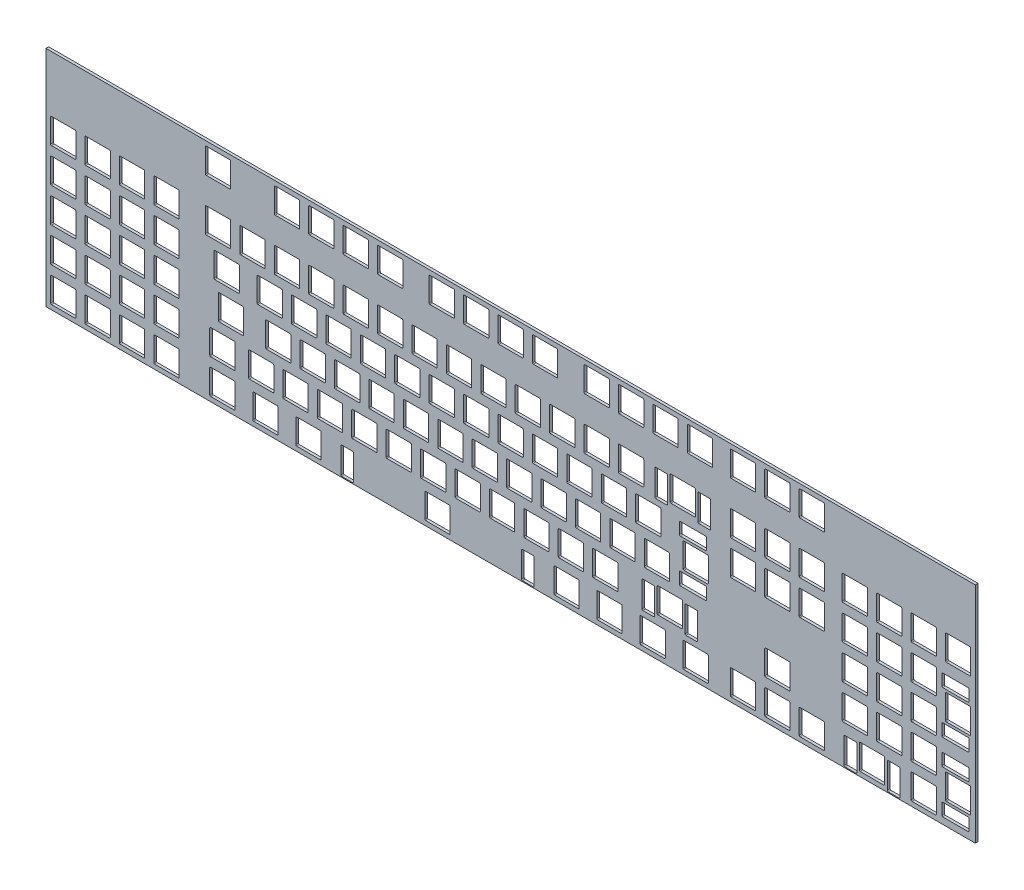
from build123d import *

# Parameters (mm, degrees)
MODEL_W             = 514.35
MODEL_H             = 123.825
BOSS_EXTRUDE1_DEPTH = 1.5


with BuildPart() as part:
    # Model → Boss-Extrude1 (new body)
    with BuildSketch(Plane.XY):
        with Locations((257.175, -61.9125)):
            Rectangle(MODEL_W, MODEL_H)
        with BuildLine():
            Line((88.75, -2.525), (101.75, -2.525))
            ThreePointArc((101.75, -2.525), (102.103553391, -2.671446609), (102.25, -3.025))
            Line((102.25, -3.025), (102.25, -16.025))
            ThreePointArc((102.25, -16.025), (102.103553391, -16.378553391), (101.75, -16.525))
            Line((101.75, -16.525), (88.75, -16.525))
            ThreePointArc((88.75, -16.525), (88.396446609, -16.378553391), (88.25, -16.025))
            Line((88.25, -16.025), (88.25, -3.025))
            ThreePointArc((88.25, -3.025), (88.396446609, -2.671446609), (88.75, -2.525))
        make_face(mode=Mode.SUBTRACT)
        with BuildLine():
            Line((126.85, -2.525), (139.85, -2.525))
            ThreePointArc((139.85, -2.525), (140.203553391, -2.671446609), (140.35, -3.025))
            Line((140.35, -3.025), (140.35, -16.025))
            ThreePointArc((140.35, -16.025), (140.203553391, -16.378553391), (139.85, -16.525))
            Line((139.85, -16.525), (126.85, -16.525))
            ThreePointArc((126.85, -16.525), (126.496446609, -16.378553391), (126.35, -16.025))
            Line((126.35, -16.025), (126.35, -3.025))
            ThreePointArc((126.35, -3.025), (126.496446609, -2.671446609), (126.85, -2.525))
        make_face(mode=Mode.SUBTRACT)
        with BuildLine():
            Line((145.9, -2.525), (158.9, -2.525))
            ThreePointArc((158.9, -2.525), (159.253553391, -2.671446609), (159.4, -3.025))
            Line((159.4, -3.025), (159.4, -16.025))
            ThreePointArc((159.4, -16.025), (159.253553391, -16.378553391), (158.9, -16.525))
            Line((158.9, -16.525), (145.9, -16.525))
            ThreePointArc((145.9, -16.525), (145.546446609, -16.378553391), (145.4, -16.025))
            Line((145.4, -16.025), (145.4, -3.025))
            ThreePointArc((145.4, -3.025), (145.546446609, -2.671446609), (145.9, -2.525))
        make_face(mode=Mode.SUBTRACT)
        with BuildLine():
            Line((164.95, -2.525), (177.95, -2.525))
            ThreePointArc((177.95, -2.525), (178.303553391, -2.671446609), (178.45, -3.025))
            Line((178.45, -3.025), (178.45, -16.025))
            ThreePointArc((178.45, -16.025), (178.303553391, -16.378553391), (177.95, -16.525))
            Line((177.95, -16.525), (164.95, -16.525))
            ThreePointArc((164.95, -16.525), (164.596446609, -16.378553391), (164.45, -16.025))
            Line((164.45, -16.025), (164.45, -3.025))
            ThreePointArc((164.45, -3.025), (164.596446609, -2.671446609), (164.95, -2.525))
        make_face(mode=Mode.SUBTRACT)
        with BuildLine():
            Line((184, -2.525), (197, -2.525))
            ThreePointArc((197, -2.525), (197.353553391, -2.671446609), (197.5, -3.025))
            Line((197.5, -3.025), (197.5, -16.025))
            ThreePointArc((197.5, -16.025), (197.353553391, -16.378553391), (197, -16.525))
            Line((197, -16.525), (184, -16.525))
            ThreePointArc((184, -16.525), (183.646446609, -16.378553391), (183.5, -16.025))
            Line((183.5, -16.025), (183.5, -3.025))
            ThreePointArc((183.5, -3.025), (183.646446609, -2.671446609), (184, -2.525))
        make_face(mode=Mode.SUBTRACT)
        with BuildLine():
            Line((212.575, -2.525), (225.575, -2.525))
            ThreePointArc((225.575, -2.525), (225.928553391, -2.671446609), (226.075, -3.025))
            Line((226.075, -3.025), (226.075, -16.025))
            ThreePointArc((226.075, -16.025), (225.928553391, -16.378553391), (225.575, -16.525))
            Line((225.575, -16.525), (212.575, -16.525))
            ThreePointArc((212.575, -16.525), (212.221446609, -16.378553391), (212.075, -16.025))
            Line((212.075, -16.025), (212.075, -3.025))
            ThreePointArc((212.075, -3.025), (212.221446609, -2.671446609), (212.575, -2.525))
        make_face(mode=Mode.SUBTRACT)
        with BuildLine():
            Line((231.625, -2.525), (244.625, -2.525))
            ThreePointArc((244.625, -2.525), (244.978553391, -2.671446609), (245.125, -3.025))
            Line((245.125, -3.025), (245.125, -16.025))
            ThreePointArc((245.125, -16.025), (244.978553391, -16.378553391), (244.625, -16.525))
            Line((244.625, -16.525), (231.625, -16.525))
            ThreePointArc((231.625, -16.525), (231.271446609, -16.378553391), (231.125, -16.025))
            Line((231.125, -16.025), (231.125, -3.025))
            ThreePointArc((231.125, -3.025), (231.271446609, -2.671446609), (231.625, -2.525))
        make_face(mode=Mode.SUBTRACT)
        with BuildLine():
            Line((250.675, -2.525), (263.675, -2.525))
            ThreePointArc((263.675, -2.525), (264.028553391, -2.671446609), (264.175, -3.025))
            Line((264.175, -3.025), (264.175, -16.025))
            ThreePointArc((264.175, -16.025), (264.028553391, -16.378553391), (263.675, -16.525))
            Line((263.675, -16.525), (250.675, -16.525))
            ThreePointArc((250.675, -16.525), (250.321446609, -16.378553391), (250.175, -16.025))
            Line((250.175, -16.025), (250.175, -3.025))
            ThreePointArc((250.175, -3.025), (250.321446609, -2.671446609), (250.675, -2.525))
        make_face(mode=Mode.SUBTRACT)
        with BuildLine():
            Line((269.725, -2.525), (282.725, -2.525))
            ThreePointArc((282.725, -2.525), (283.078553391, -2.671446609), (283.225, -3.025))
            Line((283.225, -3.025), (283.225, -16.025))
            ThreePointArc((283.225, -16.025), (283.078553391, -16.378553391), (282.725, -16.525))
            Line((282.725, -16.525), (269.725, -16.525))
            ThreePointArc((269.725, -16.525), (269.371446609, -16.378553391), (269.225, -16.025))
            Line((269.225, -16.025), (269.225, -3.025))
            ThreePointArc((269.225, -3.025), (269.371446609, -2.671446609), (269.725, -2.525))
        make_face(mode=Mode.SUBTRACT)
        with BuildLine():
            Line((298.3, -2.525), (311.3, -2.525))
            ThreePointArc((311.3, -2.525), (311.653553391, -2.671446609), (311.8, -3.025))
            Line((311.8, -3.025), (311.8, -16.025))
            ThreePointArc((311.8, -16.025), (311.653553391, -16.378553391), (311.3, -16.525))
            Line((311.3, -16.525), (298.3, -16.525))
            ThreePointArc((298.3, -16.525), (297.946446609, -16.378553391), (297.8, -16.025))
            Line((297.8, -16.025), (297.8, -3.025))
            ThreePointArc((297.8, -3.025), (297.946446609, -2.671446609), (298.3, -2.525))
        make_face(mode=Mode.SUBTRACT)
        with BuildLine():
            Line((317.35, -2.525), (330.35, -2.525))
            ThreePointArc((330.35, -2.525), (330.703553391, -2.671446609), (330.85, -3.025))
            Line((330.85, -3.025), (330.85, -16.025))
            ThreePointArc((330.85, -16.025), (330.703553391, -16.378553391), (330.35, -16.525))
            Line((330.35, -16.525), (317.35, -16.525))
            ThreePointArc((317.35, -16.525), (316.996446609, -16.378553391), (316.85, -16.025))
            Line((316.85, -16.025), (316.85, -3.025))
            ThreePointArc((316.85, -3.025), (316.996446609, -2.671446609), (317.35, -2.525))
        make_face(mode=Mode.SUBTRACT)
        with BuildLine():
            Line((336.4, -2.525), (349.4, -2.525))
            ThreePointArc((349.4, -2.525), (349.753553391, -2.671446609), (349.9, -3.025))
            Line((349.9, -3.025), (349.9, -16.025))
            ThreePointArc((349.9, -16.025), (349.753553391, -16.378553391), (349.4, -16.525))
            Line((349.4, -16.525), (336.4, -16.525))
            ThreePointArc((336.4, -16.525), (336.046446609, -16.378553391), (335.9, -16.025))
            Line((335.9, -16.025), (335.9, -3.025))
            ThreePointArc((335.9, -3.025), (336.046446609, -2.671446609), (336.4, -2.525))
        make_face(mode=Mode.SUBTRACT)
        with BuildLine():
            Line((355.45, -2.525), (368.45, -2.525))
            ThreePointArc((368.45, -2.525), (368.803553391, -2.671446609), (368.95, -3.025))
            Line((368.95, -3.025), (368.95, -16.025))
            ThreePointArc((368.95, -16.025), (368.803553391, -16.378553391), (368.45, -16.525))
            Line((368.45, -16.525), (355.45, -16.525))
            ThreePointArc((355.45, -16.525), (355.096446609, -16.378553391), (354.95, -16.025))
            Line((354.95, -16.025), (354.95, -3.025))
            ThreePointArc((354.95, -3.025), (355.096446609, -2.671446609), (355.45, -2.525))
        make_face(mode=Mode.SUBTRACT)
        with BuildLine():
            Line((379.2625, -2.525), (392.2625, -2.525))
            ThreePointArc((392.2625, -2.525), (392.616053391, -2.671446609), (392.7625, -3.025))
            Line((392.7625, -3.025), (392.7625, -16.025))
            ThreePointArc((392.7625, -16.025), (392.616053391, -16.378553391), (392.2625, -16.525))
            Line((392.2625, -16.525), (379.2625, -16.525))
            ThreePointArc((379.2625, -16.525), (378.908946609, -16.378553391), (378.7625, -16.025))
            Line((378.7625, -16.025), (378.7625, -3.025))
            ThreePointArc((378.7625, -3.025), (378.908946609, -2.671446609), (379.2625, -2.525))
        make_face(mode=Mode.SUBTRACT)
        with BuildLine():
            Line((398.3125, -2.525), (411.3125, -2.525))
            ThreePointArc((411.3125, -2.525), (411.666053391, -2.671446609), (411.8125, -3.025))
            Line((411.8125, -3.025), (411.8125, -16.025))
            ThreePointArc((411.8125, -16.025), (411.666053391, -16.378553391), (411.3125, -16.525))
            Line((411.3125, -16.525), (398.3125, -16.525))
            ThreePointArc((398.3125, -16.525), (397.958946609, -16.378553391), (397.8125, -16.025))
            Line((397.8125, -16.025), (397.8125, -3.025))
            ThreePointArc((397.8125, -3.025), (397.958946609, -2.671446609), (398.3125, -2.525))
        make_face(mode=Mode.SUBTRACT)
        with BuildLine():
            Line((417.3625, -2.525), (430.3625, -2.525))
            ThreePointArc((430.3625, -2.525), (430.716053391, -2.671446609), (430.8625, -3.025))
            Line((430.8625, -3.025), (430.8625, -16.025))
            ThreePointArc((430.8625, -16.025), (430.716053391, -16.378553391), (430.3625, -16.525))
            Line((430.3625, -16.525), (417.3625, -16.525))
            ThreePointArc((417.3625, -16.525), (417.008946609, -16.378553391), (416.8625, -16.025))
            Line((416.8625, -16.025), (416.8625, -3.025))
            ThreePointArc((416.8625, -3.025), (417.008946609, -2.671446609), (417.3625, -2.525))
        make_face(mode=Mode.SUBTRACT)
        with BuildLine():
            Line((3.025, -31.1), (16.025, -31.1))
            ThreePointArc((16.025, -31.1), (16.378553391, -31.246446609), (16.525, -31.6))
            Line((16.525, -31.6), (16.525, -44.6))
            ThreePointArc((16.525, -44.6), (16.378553391, -44.953553391), (16.025, -45.1))
            Line((16.025, -45.1), (3.025, -45.1))
            ThreePointArc((3.025, -45.1), (2.671446609, -44.953553391), (2.525, -44.6))
            Line((2.525, -44.6), (2.525, -31.6))
            ThreePointArc((2.525, -31.6), (2.671446609, -31.246446609), (3.025, -31.1))
        make_face(mode=Mode.SUBTRACT)
        with BuildLine():
            Line((22.075, -31.1), (35.075, -31.1))
            ThreePointArc((35.075, -31.1), (35.428553391, -31.246446609), (35.575, -31.6))
            Line((35.575, -31.6), (35.575, -44.6))
            ThreePointArc((35.575, -44.6), (35.428553391, -44.953553391), (35.075, -45.1))
            Line((35.075, -45.1), (22.075, -45.1))
            ThreePointArc((22.075, -45.1), (21.721446609, -44.953553391), (21.575, -44.6))
            Line((21.575, -44.6), (21.575, -31.6))
            ThreePointArc((21.575, -31.6), (21.721446609, -31.246446609), (22.075, -31.1))
        make_face(mode=Mode.SUBTRACT)
        with BuildLine():
            Line((41.125, -31.1), (54.125, -31.1))
            ThreePointArc((54.125, -31.1), (54.478553391, -31.246446609), (54.625, -31.6))
            Line((54.625, -31.6), (54.625, -44.6))
            ThreePointArc((54.625, -44.6), (54.478553391, -44.953553391), (54.125, -45.1))
            Line((54.125, -45.1), (41.125, -45.1))
            ThreePointArc((41.125, -45.1), (40.771446609, -44.953553391), (40.625, -44.6))
            Line((40.625, -44.6), (40.625, -31.6))
            ThreePointArc((40.625, -31.6), (40.771446609, -31.246446609), (41.125, -31.1))
        make_face(mode=Mode.SUBTRACT)
        with BuildLine():
            Line((60.175, -31.1), (73.175, -31.1))
            ThreePointArc((73.175, -31.1), (73.528553391, -31.246446609), (73.675, -31.6))
            Line((73.675, -31.6), (73.675, -44.6))
            ThreePointArc((73.675, -44.6), (73.528553391, -44.953553391), (73.175, -45.1))
            Line((73.175, -45.1), (60.175, -45.1))
            ThreePointArc((60.175, -45.1), (59.821446609, -44.953553391), (59.675, -44.6))
            Line((59.675, -44.6), (59.675, -31.6))
            ThreePointArc((59.675, -31.6), (59.821446609, -31.246446609), (60.175, -31.1))
        make_face(mode=Mode.SUBTRACT)
        with BuildLine():
            Line((88.75, -31.1), (101.75, -31.1))
            ThreePointArc((101.75, -31.1), (102.103553391, -31.246446609), (102.25, -31.6))
            Line((102.25, -31.6), (102.25, -44.6))
            ThreePointArc((102.25, -44.6), (102.103553391, -44.953553391), (101.75, -45.1))
            Line((101.75, -45.1), (88.75, -45.1))
            ThreePointArc((88.75, -45.1), (88.396446609, -44.953553391), (88.25, -44.6))
            Line((88.25, -44.6), (88.25, -31.6))
            ThreePointArc((88.25, -31.6), (88.396446609, -31.246446609), (88.75, -31.1))
        make_face(mode=Mode.SUBTRACT)
        with BuildLine():
            Line((107.8, -31.1), (120.8, -31.1))
            ThreePointArc((120.8, -31.1), (121.153553391, -31.246446609), (121.3, -31.6))
            Line((121.3, -31.6), (121.3, -44.6))
            ThreePointArc((121.3, -44.6), (121.153553391, -44.953553391), (120.8, -45.1))
            Line((120.8, -45.1), (107.8, -45.1))
            ThreePointArc((107.8, -45.1), (107.446446609, -44.953553391), (107.3, -44.6))
            Line((107.3, -44.6), (107.3, -31.6))
            ThreePointArc((107.3, -31.6), (107.446446609, -31.246446609), (107.8, -31.1))
        make_face(mode=Mode.SUBTRACT)
        with BuildLine():
            Line((126.85, -31.1), (139.85, -31.1))
            ThreePointArc((139.85, -31.1), (140.203553391, -31.246446609), (140.35, -31.6))
            Line((140.35, -31.6), (140.35, -44.6))
            ThreePointArc((140.35, -44.6), (140.203553391, -44.953553391), (139.85, -45.1))
            Line((139.85, -45.1), (126.85, -45.1))
            ThreePointArc((126.85, -45.1), (126.496446609, -44.953553391), (126.35, -44.6))
            Line((126.35, -44.6), (126.35, -31.6))
            ThreePointArc((126.35, -31.6), (126.496446609, -31.246446609), (126.85, -31.1))
        make_face(mode=Mode.SUBTRACT)
        with BuildLine():
            Line((145.9, -31.1), (158.9, -31.1))
            ThreePointArc((158.9, -31.1), (159.253553391, -31.246446609), (159.4, -31.6))
            Line((159.4, -31.6), (159.4, -44.6))
            ThreePointArc((159.4, -44.6), (159.253553391, -44.953553391), (158.9, -45.1))
            Line((158.9, -45.1), (145.9, -45.1))
            ThreePointArc((145.9, -45.1), (145.546446609, -44.953553391), (145.4, -44.6))
            Line((145.4, -44.6), (145.4, -31.6))
            ThreePointArc((145.4, -31.6), (145.546446609, -31.246446609), (145.9, -31.1))
        make_face(mode=Mode.SUBTRACT)
        with BuildLine():
            Line((164.95, -31.1), (177.95, -31.1))
            ThreePointArc((177.95, -31.1), (178.303553391, -31.246446609), (178.45, -31.6))
            Line((178.45, -31.6), (178.45, -44.6))
            ThreePointArc((178.45, -44.6), (178.303553391, -44.953553391), (177.95, -45.1))
            Line((177.95, -45.1), (164.95, -45.1))
            ThreePointArc((164.95, -45.1), (164.596446609, -44.953553391), (164.45, -44.6))
            Line((164.45, -44.6), (164.45, -31.6))
            ThreePointArc((164.45, -31.6), (164.596446609, -31.246446609), (164.95, -31.1))
        make_face(mode=Mode.SUBTRACT)
        with BuildLine():
            Line((184, -31.1), (197, -31.1))
            ThreePointArc((197, -31.1), (197.353553391, -31.246446609), (197.5, -31.6))
            Line((197.5, -31.6), (197.5, -44.6))
            ThreePointArc((197.5, -44.6), (197.353553391, -44.953553391), (197, -45.1))
            Line((197, -45.1), (184, -45.1))
            ThreePointArc((184, -45.1), (183.646446609, -44.953553391), (183.5, -44.6))
            Line((183.5, -44.6), (183.5, -31.6))
            ThreePointArc((183.5, -31.6), (183.646446609, -31.246446609), (184, -31.1))
        make_face(mode=Mode.SUBTRACT)
        with BuildLine():
            Line((203.05, -31.1), (216.05, -31.1))
            ThreePointArc((216.05, -31.1), (216.403553391, -31.246446609), (216.55, -31.6))
            Line((216.55, -31.6), (216.55, -44.6))
            ThreePointArc((216.55, -44.6), (216.403553391, -44.953553391), (216.05, -45.1))
            Line((216.05, -45.1), (203.05, -45.1))
            ThreePointArc((203.05, -45.1), (202.696446609, -44.953553391), (202.55, -44.6))
            Line((202.55, -44.6), (202.55, -31.6))
            ThreePointArc((202.55, -31.6), (202.696446609, -31.246446609), (203.05, -31.1))
        make_face(mode=Mode.SUBTRACT)
        with BuildLine():
            Line((222.1, -31.1), (235.1, -31.1))
            ThreePointArc((235.1, -31.1), (235.453553391, -31.246446609), (235.6, -31.6))
            Line((235.6, -31.6), (235.6, -44.6))
            ThreePointArc((235.6, -44.6), (235.453553391, -44.953553391), (235.1, -45.1))
            Line((235.1, -45.1), (222.1, -45.1))
            ThreePointArc((222.1, -45.1), (221.746446609, -44.953553391), (221.6, -44.6))
            Line((221.6, -44.6), (221.6, -31.6))
            ThreePointArc((221.6, -31.6), (221.746446609, -31.246446609), (222.1, -31.1))
        make_face(mode=Mode.SUBTRACT)
        with BuildLine():
            Line((241.15, -31.1), (254.15, -31.1))
            ThreePointArc((254.15, -31.1), (254.503553391, -31.246446609), (254.65, -31.6))
            Line((254.65, -31.6), (254.65, -44.6))
            ThreePointArc((254.65, -44.6), (254.503553391, -44.953553391), (254.15, -45.1))
            Line((254.15, -45.1), (241.15, -45.1))
            ThreePointArc((241.15, -45.1), (240.796446609, -44.953553391), (240.65, -44.6))
            Line((240.65, -44.6), (240.65, -31.6))
            ThreePointArc((240.65, -31.6), (240.796446609, -31.246446609), (241.15, -31.1))
        make_face(mode=Mode.SUBTRACT)
        with BuildLine():
            Line((260.2, -31.1), (273.2, -31.1))
            ThreePointArc((273.2, -31.1), (273.553553391, -31.246446609), (273.7, -31.6))
            Line((273.7, -31.6), (273.7, -44.6))
            ThreePointArc((273.7, -44.6), (273.553553391, -44.953553391), (273.2, -45.1))
            Line((273.2, -45.1), (260.2, -45.1))
            ThreePointArc((260.2, -45.1), (259.846446609, -44.953553391), (259.7, -44.6))
            Line((259.7, -44.6), (259.7, -31.6))
            ThreePointArc((259.7, -31.6), (259.846446609, -31.246446609), (260.2, -31.1))
        make_face(mode=Mode.SUBTRACT)
        with BuildLine():
            Line((279.25, -31.1), (292.25, -31.1))
            ThreePointArc((292.25, -31.1), (292.603553391, -31.246446609), (292.75, -31.6))
            Line((292.75, -31.6), (292.75, -44.6))
            ThreePointArc((292.75, -44.6), (292.603553391, -44.953553391), (292.25, -45.1))
            Line((292.25, -45.1), (279.25, -45.1))
            ThreePointArc((279.25, -45.1), (278.896446609, -44.953553391), (278.75, -44.6))
            Line((278.75, -44.6), (278.75, -31.6))
            ThreePointArc((278.75, -31.6), (278.896446609, -31.246446609), (279.25, -31.1))
        make_face(mode=Mode.SUBTRACT)
        with BuildLine():
            Line((298.3, -31.1), (311.3, -31.1))
            ThreePointArc((311.3, -31.1), (311.653553391, -31.246446609), (311.8, -31.6))
            Line((311.8, -31.6), (311.8, -44.6))
            ThreePointArc((311.8, -44.6), (311.653553391, -44.953553391), (311.3, -45.1))
            Line((311.3, -45.1), (298.3, -45.1))
            ThreePointArc((298.3, -45.1), (297.946446609, -44.953553391), (297.8, -44.6))
            Line((297.8, -44.6), (297.8, -31.6))
            ThreePointArc((297.8, -31.6), (297.946446609, -31.246446609), (298.3, -31.1))
        make_face(mode=Mode.SUBTRACT)
        with BuildLine():
            Line((317.35, -31.1), (330.35, -31.1))
            ThreePointArc((330.35, -31.1), (330.703553391, -31.246446609), (330.85, -31.6))
            Line((330.85, -31.6), (330.85, -44.6))
            ThreePointArc((330.85, -44.6), (330.703553391, -44.953553391), (330.35, -45.1))
            Line((330.35, -45.1), (317.35, -45.1))
            ThreePointArc((317.35, -45.1), (316.996446609, -44.953553391), (316.85, -44.6))
            Line((316.85, -44.6), (316.85, -31.6))
            ThreePointArc((316.85, -31.6), (316.996446609, -31.246446609), (317.35, -31.1))
        make_face(mode=Mode.SUBTRACT)
        with BuildLine():
            Line((345.925, -31.1), (358.925, -31.1))
            ThreePointArc((358.925, -31.1), (359.278553391, -31.246446609), (359.425, -31.6))
            Line((359.425, -31.6), (359.425, -44.6))
            ThreePointArc((359.425, -44.6), (359.278553391, -44.953553391), (358.925, -45.1))
            Line((358.925, -45.1), (345.925, -45.1))
            ThreePointArc((345.925, -45.1), (345.571446609, -44.953553391), (345.425, -44.6))
            Line((345.425, -44.6), (345.425, -31.6))
            ThreePointArc((345.425, -31.6), (345.571446609, -31.246446609), (345.925, -31.1))
        make_face(mode=Mode.SUBTRACT)
        with BuildLine():
            Line((337.487, -32.1), (343.487, -32.1))
            ThreePointArc((343.487, -32.1), (343.840553391, -32.246446609), (343.987, -32.6))
            Line((343.987, -32.6), (343.987, -46.6))
            ThreePointArc((343.987, -46.6), (343.840553391, -46.953553391), (343.487, -47.1))
            Line((343.487, -47.1), (337.487, -47.1))
            ThreePointArc((337.487, -47.1), (337.133446609, -46.953553391), (336.987, -46.6))
            Line((336.987, -46.6), (336.987, -32.6))
            ThreePointArc((336.987, -32.6), (337.133446609, -32.246446609), (337.487, -32.1))
        make_face(mode=Mode.SUBTRACT)
        with BuildLine():
            Line((361.363, -32.1), (367.363, -32.1))
            ThreePointArc((367.363, -32.1), (367.716553391, -32.246446609), (367.863, -32.6))
            Line((367.863, -32.6), (367.863, -46.6))
            ThreePointArc((367.863, -46.6), (367.716553391, -46.953553391), (367.363, -47.1))
            Line((367.363, -47.1), (361.363, -47.1))
            ThreePointArc((361.363, -47.1), (361.009446609, -46.953553391), (360.863, -46.6))
            Line((360.863, -46.6), (360.863, -32.6))
            ThreePointArc((360.863, -32.6), (361.009446609, -32.246446609), (361.363, -32.1))
        make_face(mode=Mode.SUBTRACT)
        with BuildLine():
            Line((379.2625, -31.1), (392.2625, -31.1))
            ThreePointArc((392.2625, -31.1), (392.616053391, -31.246446609), (392.7625, -31.6))
            Line((392.7625, -31.6), (392.7625, -44.6))
            ThreePointArc((392.7625, -44.6), (392.616053391, -44.953553391), (392.2625, -45.1))
            Line((392.2625, -45.1), (379.2625, -45.1))
            ThreePointArc((379.2625, -45.1), (378.908946609, -44.953553391), (378.7625, -44.6))
            Line((378.7625, -44.6), (378.7625, -31.6))
            ThreePointArc((378.7625, -31.6), (378.908946609, -31.246446609), (379.2625, -31.1))
        make_face(mode=Mode.SUBTRACT)
        with BuildLine():
            Line((398.3125, -31.1), (411.3125, -31.1))
            ThreePointArc((411.3125, -31.1), (411.666053391, -31.246446609), (411.8125, -31.6))
            Line((411.8125, -31.6), (411.8125, -44.6))
            ThreePointArc((411.8125, -44.6), (411.666053391, -44.953553391), (411.3125, -45.1))
            Line((411.3125, -45.1), (398.3125, -45.1))
            ThreePointArc((398.3125, -45.1), (397.958946609, -44.953553391), (397.8125, -44.6))
            Line((397.8125, -44.6), (397.8125, -31.6))
            ThreePointArc((397.8125, -31.6), (397.958946609, -31.246446609), (398.3125, -31.1))
        make_face(mode=Mode.SUBTRACT)
        with BuildLine():
            Line((417.3625, -31.1), (430.3625, -31.1))
            ThreePointArc((430.3625, -31.1), (430.716053391, -31.246446609), (430.8625, -31.6))
            Line((430.8625, -31.6), (430.8625, -44.6))
            ThreePointArc((430.8625, -44.6), (430.716053391, -44.953553391), (430.3625, -45.1))
            Line((430.3625, -45.1), (417.3625, -45.1))
            ThreePointArc((417.3625, -45.1), (417.008946609, -44.953553391), (416.8625, -44.6))
            Line((416.8625, -44.6), (416.8625, -31.6))
            ThreePointArc((416.8625, -31.6), (417.008946609, -31.246446609), (417.3625, -31.1))
        make_face(mode=Mode.SUBTRACT)
        with BuildLine():
            Line((441.175, -31.1), (454.175, -31.1))
            ThreePointArc((454.175, -31.1), (454.528553391, -31.246446609), (454.675, -31.6))
            Line((454.675, -31.6), (454.675, -44.6))
            ThreePointArc((454.675, -44.6), (454.528553391, -44.953553391), (454.175, -45.1))
            Line((454.175, -45.1), (441.175, -45.1))
            ThreePointArc((441.175, -45.1), (440.821446609, -44.953553391), (440.675, -44.6))
            Line((440.675, -44.6), (440.675, -31.6))
            ThreePointArc((440.675, -31.6), (440.821446609, -31.246446609), (441.175, -31.1))
        make_face(mode=Mode.SUBTRACT)
        with BuildLine():
            Line((460.225, -31.1), (473.225, -31.1))
            ThreePointArc((473.225, -31.1), (473.578553391, -31.246446609), (473.725, -31.6))
            Line((473.725, -31.6), (473.725, -44.6))
            ThreePointArc((473.725, -44.6), (473.578553391, -44.953553391), (473.225, -45.1))
            Line((473.225, -45.1), (460.225, -45.1))
            ThreePointArc((460.225, -45.1), (459.871446609, -44.953553391), (459.725, -44.6))
            Line((459.725, -44.6), (459.725, -31.6))
            ThreePointArc((459.725, -31.6), (459.871446609, -31.246446609), (460.225, -31.1))
        make_face(mode=Mode.SUBTRACT)
        with BuildLine():
            Line((479.275, -31.1), (492.275, -31.1))
            ThreePointArc((492.275, -31.1), (492.628553391, -31.246446609), (492.775, -31.6))
            Line((492.775, -31.6), (492.775, -44.6))
            ThreePointArc((492.775, -44.6), (492.628553391, -44.953553391), (492.275, -45.1))
            Line((492.275, -45.1), (479.275, -45.1))
            ThreePointArc((479.275, -45.1), (478.921446609, -44.953553391), (478.775, -44.6))
            Line((478.775, -44.6), (478.775, -31.6))
            ThreePointArc((478.775, -31.6), (478.921446609, -31.246446609), (479.275, -31.1))
        make_face(mode=Mode.SUBTRACT)
        with BuildLine():
            Line((498.325, -31.1), (511.325, -31.1))
            ThreePointArc((511.325, -31.1), (511.678553391, -31.246446609), (511.825, -31.6))
            Line((511.825, -31.6), (511.825, -44.6))
            ThreePointArc((511.825, -44.6), (511.678553391, -44.953553391), (511.325, -45.1))
            Line((511.325, -45.1), (498.325, -45.1))
            ThreePointArc((498.325, -45.1), (497.971446609, -44.953553391), (497.825, -44.6))
            Line((497.825, -44.6), (497.825, -31.6))
            ThreePointArc((497.825, -31.6), (497.971446609, -31.246446609), (498.325, -31.1))
        make_face(mode=Mode.SUBTRACT)
        with BuildLine():
            Line((3.025, -50.15), (16.025, -50.15))
            ThreePointArc((16.025, -50.15), (16.378553391, -50.296446609), (16.525, -50.65))
            Line((16.525, -50.65), (16.525, -63.65))
            ThreePointArc((16.525, -63.65), (16.378553391, -64.003553391), (16.025, -64.15))
            Line((16.025, -64.15), (3.025, -64.15))
            ThreePointArc((3.025, -64.15), (2.671446609, -64.003553391), (2.525, -63.65))
            Line((2.525, -63.65), (2.525, -50.65))
            ThreePointArc((2.525, -50.65), (2.671446609, -50.296446609), (3.025, -50.15))
        make_face(mode=Mode.SUBTRACT)
        with BuildLine():
            Line((22.075, -50.15), (35.075, -50.15))
            ThreePointArc((35.075, -50.15), (35.428553391, -50.296446609), (35.575, -50.65))
            Line((35.575, -50.65), (35.575, -63.65))
            ThreePointArc((35.575, -63.65), (35.428553391, -64.003553391), (35.075, -64.15))
            Line((35.075, -64.15), (22.075, -64.15))
            ThreePointArc((22.075, -64.15), (21.721446609, -64.003553391), (21.575, -63.65))
            Line((21.575, -63.65), (21.575, -50.65))
            ThreePointArc((21.575, -50.65), (21.721446609, -50.296446609), (22.075, -50.15))
        make_face(mode=Mode.SUBTRACT)
        with BuildLine():
            Line((41.125, -50.15), (54.125, -50.15))
            ThreePointArc((54.125, -50.15), (54.478553391, -50.296446609), (54.625, -50.65))
            Line((54.625, -50.65), (54.625, -63.65))
            ThreePointArc((54.625, -63.65), (54.478553391, -64.003553391), (54.125, -64.15))
            Line((54.125, -64.15), (41.125, -64.15))
            ThreePointArc((41.125, -64.15), (40.771446609, -64.003553391), (40.625, -63.65))
            Line((40.625, -63.65), (40.625, -50.65))
            ThreePointArc((40.625, -50.65), (40.771446609, -50.296446609), (41.125, -50.15))
        make_face(mode=Mode.SUBTRACT)
        with BuildLine():
            Line((60.175, -50.15), (73.175, -50.15))
            ThreePointArc((73.175, -50.15), (73.528553391, -50.296446609), (73.675, -50.65))
            Line((73.675, -50.65), (73.675, -63.65))
            ThreePointArc((73.675, -63.65), (73.528553391, -64.003553391), (73.175, -64.15))
            Line((73.175, -64.15), (60.175, -64.15))
            ThreePointArc((60.175, -64.15), (59.821446609, -64.003553391), (59.675, -63.65))
            Line((59.675, -63.65), (59.675, -50.65))
            ThreePointArc((59.675, -50.65), (59.821446609, -50.296446609), (60.175, -50.15))
        make_face(mode=Mode.SUBTRACT)
        with BuildLine():
            Line((93.5125, -50.15), (106.5125, -50.15))
            ThreePointArc((106.5125, -50.15), (106.866053391, -50.296446609), (107.0125, -50.65))
            Line((107.0125, -50.65), (107.0125, -63.65))
            ThreePointArc((107.0125, -63.65), (106.866053391, -64.003553391), (106.5125, -64.15))
            Line((106.5125, -64.15), (93.5125, -64.15))
            ThreePointArc((93.5125, -64.15), (93.158946609, -64.003553391), (93.0125, -63.65))
            Line((93.0125, -63.65), (93.0125, -50.65))
            ThreePointArc((93.0125, -50.65), (93.158946609, -50.296446609), (93.5125, -50.15))
        make_face(mode=Mode.SUBTRACT)
        with BuildLine():
            Line((117.325, -50.15), (130.325, -50.15))
            ThreePointArc((130.325, -50.15), (130.678553391, -50.296446609), (130.825, -50.65))
            Line((130.825, -50.65), (130.825, -63.65))
            ThreePointArc((130.825, -63.65), (130.678553391, -64.003553391), (130.325, -64.15))
            Line((130.325, -64.15), (117.325, -64.15))
            ThreePointArc((117.325, -64.15), (116.971446609, -64.003553391), (116.825, -63.65))
            Line((116.825, -63.65), (116.825, -50.65))
            ThreePointArc((116.825, -50.65), (116.971446609, -50.296446609), (117.325, -50.15))
        make_face(mode=Mode.SUBTRACT)
        with BuildLine():
            Line((136.375, -50.15), (149.375, -50.15))
            ThreePointArc((149.375, -50.15), (149.728553391, -50.296446609), (149.875, -50.65))
            Line((149.875, -50.65), (149.875, -63.65))
            ThreePointArc((149.875, -63.65), (149.728553391, -64.003553391), (149.375, -64.15))
            Line((149.375, -64.15), (136.375, -64.15))
            ThreePointArc((136.375, -64.15), (136.021446609, -64.003553391), (135.875, -63.65))
            Line((135.875, -63.65), (135.875, -50.65))
            ThreePointArc((135.875, -50.65), (136.021446609, -50.296446609), (136.375, -50.15))
        make_face(mode=Mode.SUBTRACT)
        with BuildLine():
            Line((155.425, -50.15), (168.425, -50.15))
            ThreePointArc((168.425, -50.15), (168.778553391, -50.296446609), (168.925, -50.65))
            Line((168.925, -50.65), (168.925, -63.65))
            ThreePointArc((168.925, -63.65), (168.778553391, -64.003553391), (168.425, -64.15))
            Line((168.425, -64.15), (155.425, -64.15))
            ThreePointArc((155.425, -64.15), (155.071446609, -64.003553391), (154.925, -63.65))
            Line((154.925, -63.65), (154.925, -50.65))
            ThreePointArc((154.925, -50.65), (155.071446609, -50.296446609), (155.425, -50.15))
        make_face(mode=Mode.SUBTRACT)
        with BuildLine():
            Line((174.475, -50.15), (187.475, -50.15))
            ThreePointArc((187.475, -50.15), (187.828553391, -50.296446609), (187.975, -50.65))
            Line((187.975, -50.65), (187.975, -63.65))
            ThreePointArc((187.975, -63.65), (187.828553391, -64.003553391), (187.475, -64.15))
            Line((187.475, -64.15), (174.475, -64.15))
            ThreePointArc((174.475, -64.15), (174.121446609, -64.003553391), (173.975, -63.65))
            Line((173.975, -63.65), (173.975, -50.65))
            ThreePointArc((173.975, -50.65), (174.121446609, -50.296446609), (174.475, -50.15))
        make_face(mode=Mode.SUBTRACT)
        with BuildLine():
            Line((193.525, -50.15), (206.525, -50.15))
            ThreePointArc((206.525, -50.15), (206.878553391, -50.296446609), (207.025, -50.65))
            Line((207.025, -50.65), (207.025, -63.65))
            ThreePointArc((207.025, -63.65), (206.878553391, -64.003553391), (206.525, -64.15))
            Line((206.525, -64.15), (193.525, -64.15))
            ThreePointArc((193.525, -64.15), (193.171446609, -64.003553391), (193.025, -63.65))
            Line((193.025, -63.65), (193.025, -50.65))
            ThreePointArc((193.025, -50.65), (193.171446609, -50.296446609), (193.525, -50.15))
        make_face(mode=Mode.SUBTRACT)
        with BuildLine():
            Line((212.575, -50.15), (225.575, -50.15))
            ThreePointArc((225.575, -50.15), (225.928553391, -50.296446609), (226.075, -50.65))
            Line((226.075, -50.65), (226.075, -63.65))
            ThreePointArc((226.075, -63.65), (225.928553391, -64.003553391), (225.575, -64.15))
            Line((225.575, -64.15), (212.575, -64.15))
            ThreePointArc((212.575, -64.15), (212.221446609, -64.003553391), (212.075, -63.65))
            Line((212.075, -63.65), (212.075, -50.65))
            ThreePointArc((212.075, -50.65), (212.221446609, -50.296446609), (212.575, -50.15))
        make_face(mode=Mode.SUBTRACT)
        with BuildLine():
            Line((231.625, -50.15), (244.625, -50.15))
            ThreePointArc((244.625, -50.15), (244.978553391, -50.296446609), (245.125, -50.65))
            Line((245.125, -50.65), (245.125, -63.65))
            ThreePointArc((245.125, -63.65), (244.978553391, -64.003553391), (244.625, -64.15))
            Line((244.625, -64.15), (231.625, -64.15))
            ThreePointArc((231.625, -64.15), (231.271446609, -64.003553391), (231.125, -63.65))
            Line((231.125, -63.65), (231.125, -50.65))
            ThreePointArc((231.125, -50.65), (231.271446609, -50.296446609), (231.625, -50.15))
        make_face(mode=Mode.SUBTRACT)
        with BuildLine():
            Line((250.675, -50.15), (263.675, -50.15))
            ThreePointArc((263.675, -50.15), (264.028553391, -50.296446609), (264.175, -50.65))
            Line((264.175, -50.65), (264.175, -63.65))
            ThreePointArc((264.175, -63.65), (264.028553391, -64.003553391), (263.675, -64.15))
            Line((263.675, -64.15), (250.675, -64.15))
            ThreePointArc((250.675, -64.15), (250.321446609, -64.003553391), (250.175, -63.65))
            Line((250.175, -63.65), (250.175, -50.65))
            ThreePointArc((250.175, -50.65), (250.321446609, -50.296446609), (250.675, -50.15))
        make_face(mode=Mode.SUBTRACT)
        with BuildLine():
            Line((269.725, -50.15), (282.725, -50.15))
            ThreePointArc((282.725, -50.15), (283.078553391, -50.296446609), (283.225, -50.65))
            Line((283.225, -50.65), (283.225, -63.65))
            ThreePointArc((283.225, -63.65), (283.078553391, -64.003553391), (282.725, -64.15))
            Line((282.725, -64.15), (269.725, -64.15))
            ThreePointArc((269.725, -64.15), (269.371446609, -64.003553391), (269.225, -63.65))
            Line((269.225, -63.65), (269.225, -50.65))
            ThreePointArc((269.225, -50.65), (269.371446609, -50.296446609), (269.725, -50.15))
        make_face(mode=Mode.SUBTRACT)
        with BuildLine():
            Line((288.775, -50.15), (301.775, -50.15))
            ThreePointArc((301.775, -50.15), (302.128553391, -50.296446609), (302.275, -50.65))
            Line((302.275, -50.65), (302.275, -63.65))
            ThreePointArc((302.275, -63.65), (302.128553391, -64.003553391), (301.775, -64.15))
            Line((301.775, -64.15), (288.775, -64.15))
            ThreePointArc((288.775, -64.15), (288.421446609, -64.003553391), (288.275, -63.65))
            Line((288.275, -63.65), (288.275, -50.65))
            ThreePointArc((288.275, -50.65), (288.421446609, -50.296446609), (288.775, -50.15))
        make_face(mode=Mode.SUBTRACT)
        with BuildLine():
            Line((307.825, -50.15), (320.825, -50.15))
            ThreePointArc((320.825, -50.15), (321.178553391, -50.296446609), (321.325, -50.65))
            Line((321.325, -50.65), (321.325, -63.65))
            ThreePointArc((321.325, -63.65), (321.178553391, -64.003553391), (320.825, -64.15))
            Line((320.825, -64.15), (307.825, -64.15))
            ThreePointArc((307.825, -64.15), (307.471446609, -64.003553391), (307.325, -63.65))
            Line((307.325, -63.65), (307.325, -50.65))
            ThreePointArc((307.325, -50.65), (307.471446609, -50.296446609), (307.825, -50.15))
        make_face(mode=Mode.SUBTRACT)
        with BuildLine():
            Line((326.875, -50.15), (339.875, -50.15))
            ThreePointArc((339.875, -50.15), (340.228553391, -50.296446609), (340.375, -50.65))
            Line((340.375, -50.65), (340.375, -63.65))
            ThreePointArc((340.375, -63.65), (340.228553391, -64.003553391), (339.875, -64.15))
            Line((339.875, -64.15), (326.875, -64.15))
            ThreePointArc((326.875, -64.15), (326.521446609, -64.003553391), (326.375, -63.65))
            Line((326.375, -63.65), (326.375, -50.65))
            ThreePointArc((326.375, -50.65), (326.521446609, -50.296446609), (326.875, -50.15))
        make_face(mode=Mode.SUBTRACT)
        with BuildLine():
            Line((366.56875, -60.175), (366.56875, -73.175))
            ThreePointArc((366.56875, -73.175), (366.422303391, -73.528553391), (366.06875, -73.675))
            Line((366.06875, -73.675), (353.06875, -73.675))
            ThreePointArc((353.06875, -73.675), (352.715196609, -73.528553391), (352.56875, -73.175))
            Line((352.56875, -73.175), (352.56875, -60.175))
            ThreePointArc((352.56875, -60.175), (352.715196609, -59.821446609), (353.06875, -59.675))
            Line((353.06875, -59.675), (366.06875, -59.675))
            ThreePointArc((366.06875, -59.675), (366.422303391, -59.821446609), (366.56875, -60.175))
        make_face(mode=Mode.SUBTRACT)
        with BuildLine():
            Line((365.56875, -51.737), (365.56875, -57.737))
            ThreePointArc((365.56875, -57.737), (365.422303391, -58.090553391), (365.06875, -58.237))
            Line((365.06875, -58.237), (351.06875, -58.237))
            ThreePointArc((351.06875, -58.237), (350.715196609, -58.090553391), (350.56875, -57.737))
            Line((350.56875, -57.737), (350.56875, -51.737))
            ThreePointArc((350.56875, -51.737), (350.715196609, -51.383446609), (351.06875, -51.237))
            Line((351.06875, -51.237), (365.06875, -51.237))
            ThreePointArc((365.06875, -51.237), (365.422303391, -51.383446609), (365.56875, -51.737))
        make_face(mode=Mode.SUBTRACT)
        with BuildLine():
            Line((365.56875, -75.613), (365.56875, -81.613))
            ThreePointArc((365.56875, -81.613), (365.422303391, -81.966553391), (365.06875, -82.113))
            Line((365.06875, -82.113), (351.06875, -82.113))
            ThreePointArc((351.06875, -82.113), (350.715196609, -81.966553391), (350.56875, -81.613))
            Line((350.56875, -81.613), (350.56875, -75.613))
            ThreePointArc((350.56875, -75.613), (350.715196609, -75.259446609), (351.06875, -75.113))
            Line((351.06875, -75.113), (365.06875, -75.113))
            ThreePointArc((365.06875, -75.113), (365.422303391, -75.259446609), (365.56875, -75.613))
        make_face(mode=Mode.SUBTRACT)
        with BuildLine():
            Line((379.2625, -50.15), (392.2625, -50.15))
            ThreePointArc((392.2625, -50.15), (392.616053391, -50.296446609), (392.7625, -50.65))
            Line((392.7625, -50.65), (392.7625, -63.65))
            ThreePointArc((392.7625, -63.65), (392.616053391, -64.003553391), (392.2625, -64.15))
            Line((392.2625, -64.15), (379.2625, -64.15))
            ThreePointArc((379.2625, -64.15), (378.908946609, -64.003553391), (378.7625, -63.65))
            Line((378.7625, -63.65), (378.7625, -50.65))
            ThreePointArc((378.7625, -50.65), (378.908946609, -50.296446609), (379.2625, -50.15))
        make_face(mode=Mode.SUBTRACT)
        with BuildLine():
            Line((398.3125, -50.15), (411.3125, -50.15))
            ThreePointArc((411.3125, -50.15), (411.666053391, -50.296446609), (411.8125, -50.65))
            Line((411.8125, -50.65), (411.8125, -63.65))
            ThreePointArc((411.8125, -63.65), (411.666053391, -64.003553391), (411.3125, -64.15))
            Line((411.3125, -64.15), (398.3125, -64.15))
            ThreePointArc((398.3125, -64.15), (397.958946609, -64.003553391), (397.8125, -63.65))
            Line((397.8125, -63.65), (397.8125, -50.65))
            ThreePointArc((397.8125, -50.65), (397.958946609, -50.296446609), (398.3125, -50.15))
        make_face(mode=Mode.SUBTRACT)
        with BuildLine():
            Line((417.3625, -50.15), (430.3625, -50.15))
            ThreePointArc((430.3625, -50.15), (430.716053391, -50.296446609), (430.8625, -50.65))
            Line((430.8625, -50.65), (430.8625, -63.65))
            ThreePointArc((430.8625, -63.65), (430.716053391, -64.003553391), (430.3625, -64.15))
            Line((430.3625, -64.15), (417.3625, -64.15))
            ThreePointArc((417.3625, -64.15), (417.008946609, -64.003553391), (416.8625, -63.65))
            Line((416.8625, -63.65), (416.8625, -50.65))
            ThreePointArc((416.8625, -50.65), (417.008946609, -50.296446609), (417.3625, -50.15))
        make_face(mode=Mode.SUBTRACT)
        with BuildLine():
            Line((441.175, -50.15), (454.175, -50.15))
            ThreePointArc((454.175, -50.15), (454.528553391, -50.296446609), (454.675, -50.65))
            Line((454.675, -50.65), (454.675, -63.65))
            ThreePointArc((454.675, -63.65), (454.528553391, -64.003553391), (454.175, -64.15))
            Line((454.175, -64.15), (441.175, -64.15))
            ThreePointArc((441.175, -64.15), (440.821446609, -64.003553391), (440.675, -63.65))
            Line((440.675, -63.65), (440.675, -50.65))
            ThreePointArc((440.675, -50.65), (440.821446609, -50.296446609), (441.175, -50.15))
        make_face(mode=Mode.SUBTRACT)
        with BuildLine():
            Line((460.225, -50.15), (473.225, -50.15))
            ThreePointArc((473.225, -50.15), (473.578553391, -50.296446609), (473.725, -50.65))
            Line((473.725, -50.65), (473.725, -63.65))
            ThreePointArc((473.725, -63.65), (473.578553391, -64.003553391), (473.225, -64.15))
            Line((473.225, -64.15), (460.225, -64.15))
            ThreePointArc((460.225, -64.15), (459.871446609, -64.003553391), (459.725, -63.65))
            Line((459.725, -63.65), (459.725, -50.65))
            ThreePointArc((459.725, -50.65), (459.871446609, -50.296446609), (460.225, -50.15))
        make_face(mode=Mode.SUBTRACT)
        with BuildLine():
            Line((479.275, -50.15), (492.275, -50.15))
            ThreePointArc((492.275, -50.15), (492.628553391, -50.296446609), (492.775, -50.65))
            Line((492.775, -50.65), (492.775, -63.65))
            ThreePointArc((492.775, -63.65), (492.628553391, -64.003553391), (492.275, -64.15))
            Line((492.275, -64.15), (479.275, -64.15))
            ThreePointArc((479.275, -64.15), (478.921446609, -64.003553391), (478.775, -63.65))
            Line((478.775, -63.65), (478.775, -50.65))
            ThreePointArc((478.775, -50.65), (478.921446609, -50.296446609), (479.275, -50.15))
        make_face(mode=Mode.SUBTRACT)
        with BuildLine():
            Line((511.825, -60.175), (511.825, -73.175))
            ThreePointArc((511.825, -73.175), (511.678553391, -73.528553391), (511.325, -73.675))
            Line((511.325, -73.675), (498.325, -73.675))
            ThreePointArc((498.325, -73.675), (497.971446609, -73.528553391), (497.825, -73.175))
            Line((497.825, -73.175), (497.825, -60.175))
            ThreePointArc((497.825, -60.175), (497.971446609, -59.821446609), (498.325, -59.675))
            Line((498.325, -59.675), (511.325, -59.675))
            ThreePointArc((511.325, -59.675), (511.678553391, -59.821446609), (511.825, -60.175))
        make_face(mode=Mode.SUBTRACT)
        with BuildLine():
            Line((510.825, -51.737), (510.825, -57.737))
            ThreePointArc((510.825, -57.737), (510.678553391, -58.090553391), (510.325, -58.237))
            Line((510.325, -58.237), (496.325, -58.237))
            ThreePointArc((496.325, -58.237), (495.971446609, -58.090553391), (495.825, -57.737))
            Line((495.825, -57.737), (495.825, -51.737))
            ThreePointArc((495.825, -51.737), (495.971446609, -51.383446609), (496.325, -51.237))
            Line((496.325, -51.237), (510.325, -51.237))
            ThreePointArc((510.325, -51.237), (510.678553391, -51.383446609), (510.825, -51.737))
        make_face(mode=Mode.SUBTRACT)
        with BuildLine():
            Line((510.825, -75.613), (510.825, -81.613))
            ThreePointArc((510.825, -81.613), (510.678553391, -81.966553391), (510.325, -82.113))
            Line((510.325, -82.113), (496.325, -82.113))
            ThreePointArc((496.325, -82.113), (495.971446609, -81.966553391), (495.825, -81.613))
            Line((495.825, -81.613), (495.825, -75.613))
            ThreePointArc((495.825, -75.613), (495.971446609, -75.259446609), (496.325, -75.113))
            Line((496.325, -75.113), (510.325, -75.113))
            ThreePointArc((510.325, -75.113), (510.678553391, -75.259446609), (510.825, -75.613))
        make_face(mode=Mode.SUBTRACT)
        with BuildLine():
            Line((3.025, -69.2), (16.025, -69.2))
            ThreePointArc((16.025, -69.2), (16.378553391, -69.346446609), (16.525, -69.7))
            Line((16.525, -69.7), (16.525, -82.7))
            ThreePointArc((16.525, -82.7), (16.378553391, -83.053553391), (16.025, -83.2))
            Line((16.025, -83.2), (3.025, -83.2))
            ThreePointArc((3.025, -83.2), (2.671446609, -83.053553391), (2.525, -82.7))
            Line((2.525, -82.7), (2.525, -69.7))
            ThreePointArc((2.525, -69.7), (2.671446609, -69.346446609), (3.025, -69.2))
        make_face(mode=Mode.SUBTRACT)
        with BuildLine():
            Line((22.075, -69.2), (35.075, -69.2))
            ThreePointArc((35.075, -69.2), (35.428553391, -69.346446609), (35.575, -69.7))
            Line((35.575, -69.7), (35.575, -82.7))
            ThreePointArc((35.575, -82.7), (35.428553391, -83.053553391), (35.075, -83.2))
            Line((35.075, -83.2), (22.075, -83.2))
            ThreePointArc((22.075, -83.2), (21.721446609, -83.053553391), (21.575, -82.7))
            Line((21.575, -82.7), (21.575, -69.7))
            ThreePointArc((21.575, -69.7), (21.721446609, -69.346446609), (22.075, -69.2))
        make_face(mode=Mode.SUBTRACT)
        with BuildLine():
            Line((41.125, -69.2), (54.125, -69.2))
            ThreePointArc((54.125, -69.2), (54.478553391, -69.346446609), (54.625, -69.7))
            Line((54.625, -69.7), (54.625, -82.7))
            ThreePointArc((54.625, -82.7), (54.478553391, -83.053553391), (54.125, -83.2))
            Line((54.125, -83.2), (41.125, -83.2))
            ThreePointArc((41.125, -83.2), (40.771446609, -83.053553391), (40.625, -82.7))
            Line((40.625, -82.7), (40.625, -69.7))
            ThreePointArc((40.625, -69.7), (40.771446609, -69.346446609), (41.125, -69.2))
        make_face(mode=Mode.SUBTRACT)
        with BuildLine():
            Line((60.175, -69.2), (73.175, -69.2))
            ThreePointArc((73.175, -69.2), (73.528553391, -69.346446609), (73.675, -69.7))
            Line((73.675, -69.7), (73.675, -82.7))
            ThreePointArc((73.675, -82.7), (73.528553391, -83.053553391), (73.175, -83.2))
            Line((73.175, -83.2), (60.175, -83.2))
            ThreePointArc((60.175, -83.2), (59.821446609, -83.053553391), (59.675, -82.7))
            Line((59.675, -82.7), (59.675, -69.7))
            ThreePointArc((59.675, -69.7), (59.821446609, -69.346446609), (60.175, -69.2))
        make_face(mode=Mode.SUBTRACT)
        with BuildLine():
            Line((95.89375, -69.2), (108.89375, -69.2))
            ThreePointArc((108.89375, -69.2), (109.247303391, -69.346446609), (109.39375, -69.7))
            Line((109.39375, -69.7), (109.39375, -82.7))
            ThreePointArc((109.39375, -82.7), (109.247303391, -83.053553391), (108.89375, -83.2))
            Line((108.89375, -83.2), (95.89375, -83.2))
            ThreePointArc((95.89375, -83.2), (95.540196609, -83.053553391), (95.39375, -82.7))
            Line((95.39375, -82.7), (95.39375, -69.7))
            ThreePointArc((95.39375, -69.7), (95.540196609, -69.346446609), (95.89375, -69.2))
        make_face(mode=Mode.SUBTRACT)
        with BuildLine():
            Line((122.0875, -69.2), (135.0875, -69.2))
            ThreePointArc((135.0875, -69.2), (135.441053391, -69.346446609), (135.5875, -69.7))
            Line((135.5875, -69.7), (135.5875, -82.7))
            ThreePointArc((135.5875, -82.7), (135.441053391, -83.053553391), (135.0875, -83.2))
            Line((135.0875, -83.2), (122.0875, -83.2))
            ThreePointArc((122.0875, -83.2), (121.733946609, -83.053553391), (121.5875, -82.7))
            Line((121.5875, -82.7), (121.5875, -69.7))
            ThreePointArc((121.5875, -69.7), (121.733946609, -69.346446609), (122.0875, -69.2))
        make_face(mode=Mode.SUBTRACT)
        with BuildLine():
            Line((141.1375, -69.2), (154.1375, -69.2))
            ThreePointArc((154.1375, -69.2), (154.491053391, -69.346446609), (154.6375, -69.7))
            Line((154.6375, -69.7), (154.6375, -82.7))
            ThreePointArc((154.6375, -82.7), (154.491053391, -83.053553391), (154.1375, -83.2))
            Line((154.1375, -83.2), (141.1375, -83.2))
            ThreePointArc((141.1375, -83.2), (140.783946609, -83.053553391), (140.6375, -82.7))
            Line((140.6375, -82.7), (140.6375, -69.7))
            ThreePointArc((140.6375, -69.7), (140.783946609, -69.346446609), (141.1375, -69.2))
        make_face(mode=Mode.SUBTRACT)
        with BuildLine():
            Line((160.1875, -69.2), (173.1875, -69.2))
            ThreePointArc((173.1875, -69.2), (173.541053391, -69.346446609), (173.6875, -69.7))
            Line((173.6875, -69.7), (173.6875, -82.7))
            ThreePointArc((173.6875, -82.7), (173.541053391, -83.053553391), (173.1875, -83.2))
            Line((173.1875, -83.2), (160.1875, -83.2))
            ThreePointArc((160.1875, -83.2), (159.833946609, -83.053553391), (159.6875, -82.7))
            Line((159.6875, -82.7), (159.6875, -69.7))
            ThreePointArc((159.6875, -69.7), (159.833946609, -69.346446609), (160.1875, -69.2))
        make_face(mode=Mode.SUBTRACT)
        with BuildLine():
            Line((179.2375, -69.2), (192.2375, -69.2))
            ThreePointArc((192.2375, -69.2), (192.591053391, -69.346446609), (192.7375, -69.7))
            Line((192.7375, -69.7), (192.7375, -82.7))
            ThreePointArc((192.7375, -82.7), (192.591053391, -83.053553391), (192.2375, -83.2))
            Line((192.2375, -83.2), (179.2375, -83.2))
            ThreePointArc((179.2375, -83.2), (178.883946609, -83.053553391), (178.7375, -82.7))
            Line((178.7375, -82.7), (178.7375, -69.7))
            ThreePointArc((178.7375, -69.7), (178.883946609, -69.346446609), (179.2375, -69.2))
        make_face(mode=Mode.SUBTRACT)
        with BuildLine():
            Line((198.2875, -69.2), (211.2875, -69.2))
            ThreePointArc((211.2875, -69.2), (211.641053391, -69.346446609), (211.7875, -69.7))
            Line((211.7875, -69.7), (211.7875, -82.7))
            ThreePointArc((211.7875, -82.7), (211.641053391, -83.053553391), (211.2875, -83.2))
            Line((211.2875, -83.2), (198.2875, -83.2))
            ThreePointArc((198.2875, -83.2), (197.933946609, -83.053553391), (197.7875, -82.7))
            Line((197.7875, -82.7), (197.7875, -69.7))
            ThreePointArc((197.7875, -69.7), (197.933946609, -69.346446609), (198.2875, -69.2))
        make_face(mode=Mode.SUBTRACT)
        with BuildLine():
            Line((217.3375, -69.2), (230.3375, -69.2))
            ThreePointArc((230.3375, -69.2), (230.691053391, -69.346446609), (230.8375, -69.7))
            Line((230.8375, -69.7), (230.8375, -82.7))
            ThreePointArc((230.8375, -82.7), (230.691053391, -83.053553391), (230.3375, -83.2))
            Line((230.3375, -83.2), (217.3375, -83.2))
            ThreePointArc((217.3375, -83.2), (216.983946609, -83.053553391), (216.8375, -82.7))
            Line((216.8375, -82.7), (216.8375, -69.7))
            ThreePointArc((216.8375, -69.7), (216.983946609, -69.346446609), (217.3375, -69.2))
        make_face(mode=Mode.SUBTRACT)
        with BuildLine():
            Line((236.3875, -69.2), (249.3875, -69.2))
            ThreePointArc((249.3875, -69.2), (249.741053391, -69.346446609), (249.8875, -69.7))
            Line((249.8875, -69.7), (249.8875, -82.7))
            ThreePointArc((249.8875, -82.7), (249.741053391, -83.053553391), (249.3875, -83.2))
            Line((249.3875, -83.2), (236.3875, -83.2))
            ThreePointArc((236.3875, -83.2), (236.033946609, -83.053553391), (235.8875, -82.7))
            Line((235.8875, -82.7), (235.8875, -69.7))
            ThreePointArc((235.8875, -69.7), (236.033946609, -69.346446609), (236.3875, -69.2))
        make_face(mode=Mode.SUBTRACT)
        with BuildLine():
            Line((255.4375, -69.2), (268.4375, -69.2))
            ThreePointArc((268.4375, -69.2), (268.791053391, -69.346446609), (268.9375, -69.7))
            Line((268.9375, -69.7), (268.9375, -82.7))
            ThreePointArc((268.9375, -82.7), (268.791053391, -83.053553391), (268.4375, -83.2))
            Line((268.4375, -83.2), (255.4375, -83.2))
            ThreePointArc((255.4375, -83.2), (255.083946609, -83.053553391), (254.9375, -82.7))
            Line((254.9375, -82.7), (254.9375, -69.7))
            ThreePointArc((254.9375, -69.7), (255.083946609, -69.346446609), (255.4375, -69.2))
        make_face(mode=Mode.SUBTRACT)
        with BuildLine():
            Line((274.4875, -69.2), (287.4875, -69.2))
            ThreePointArc((287.4875, -69.2), (287.841053391, -69.346446609), (287.9875, -69.7))
            Line((287.9875, -69.7), (287.9875, -82.7))
            ThreePointArc((287.9875, -82.7), (287.841053391, -83.053553391), (287.4875, -83.2))
            Line((287.4875, -83.2), (274.4875, -83.2))
            ThreePointArc((274.4875, -83.2), (274.133946609, -83.053553391), (273.9875, -82.7))
            Line((273.9875, -82.7), (273.9875, -69.7))
            ThreePointArc((273.9875, -69.7), (274.133946609, -69.346446609), (274.4875, -69.2))
        make_face(mode=Mode.SUBTRACT)
        with BuildLine():
            Line((293.5375, -69.2), (306.5375, -69.2))
            ThreePointArc((306.5375, -69.2), (306.891053391, -69.346446609), (307.0375, -69.7))
            Line((307.0375, -69.7), (307.0375, -82.7))
            ThreePointArc((307.0375, -82.7), (306.891053391, -83.053553391), (306.5375, -83.2))
            Line((306.5375, -83.2), (293.5375, -83.2))
            ThreePointArc((293.5375, -83.2), (293.183946609, -83.053553391), (293.0375, -82.7))
            Line((293.0375, -82.7), (293.0375, -69.7))
            ThreePointArc((293.0375, -69.7), (293.183946609, -69.346446609), (293.5375, -69.2))
        make_face(mode=Mode.SUBTRACT)
        with BuildLine():
            Line((312.5875, -69.2), (325.5875, -69.2))
            ThreePointArc((325.5875, -69.2), (325.941053391, -69.346446609), (326.0875, -69.7))
            Line((326.0875, -69.7), (326.0875, -82.7))
            ThreePointArc((326.0875, -82.7), (325.941053391, -83.053553391), (325.5875, -83.2))
            Line((325.5875, -83.2), (312.5875, -83.2))
            ThreePointArc((312.5875, -83.2), (312.233946609, -83.053553391), (312.0875, -82.7))
            Line((312.0875, -82.7), (312.0875, -69.7))
            ThreePointArc((312.0875, -69.7), (312.233946609, -69.346446609), (312.5875, -69.2))
        make_face(mode=Mode.SUBTRACT)
        with BuildLine():
            Line((331.6375, -69.2), (344.6375, -69.2))
            ThreePointArc((344.6375, -69.2), (344.991053391, -69.346446609), (345.1375, -69.7))
            Line((345.1375, -69.7), (345.1375, -82.7))
            ThreePointArc((345.1375, -82.7), (344.991053391, -83.053553391), (344.6375, -83.2))
            Line((344.6375, -83.2), (331.6375, -83.2))
            ThreePointArc((331.6375, -83.2), (331.283946609, -83.053553391), (331.1375, -82.7))
            Line((331.1375, -82.7), (331.1375, -69.7))
            ThreePointArc((331.1375, -69.7), (331.283946609, -69.346446609), (331.6375, -69.2))
        make_face(mode=Mode.SUBTRACT)
        with BuildLine():
            Line((441.175, -69.2), (454.175, -69.2))
            ThreePointArc((454.175, -69.2), (454.528553391, -69.346446609), (454.675, -69.7))
            Line((454.675, -69.7), (454.675, -82.7))
            ThreePointArc((454.675, -82.7), (454.528553391, -83.053553391), (454.175, -83.2))
            Line((454.175, -83.2), (441.175, -83.2))
            ThreePointArc((441.175, -83.2), (440.821446609, -83.053553391), (440.675, -82.7))
            Line((440.675, -82.7), (440.675, -69.7))
            ThreePointArc((440.675, -69.7), (440.821446609, -69.346446609), (441.175, -69.2))
        make_face(mode=Mode.SUBTRACT)
        with BuildLine():
            Line((460.225, -69.2), (473.225, -69.2))
            ThreePointArc((473.225, -69.2), (473.578553391, -69.346446609), (473.725, -69.7))
            Line((473.725, -69.7), (473.725, -82.7))
            ThreePointArc((473.725, -82.7), (473.578553391, -83.053553391), (473.225, -83.2))
            Line((473.225, -83.2), (460.225, -83.2))
            ThreePointArc((460.225, -83.2), (459.871446609, -83.053553391), (459.725, -82.7))
            Line((459.725, -82.7), (459.725, -69.7))
            ThreePointArc((459.725, -69.7), (459.871446609, -69.346446609), (460.225, -69.2))
        make_face(mode=Mode.SUBTRACT)
        with BuildLine():
            Line((479.275, -69.2), (492.275, -69.2))
            ThreePointArc((492.275, -69.2), (492.628553391, -69.346446609), (492.775, -69.7))
            Line((492.775, -69.7), (492.775, -82.7))
            ThreePointArc((492.775, -82.7), (492.628553391, -83.053553391), (492.275, -83.2))
            Line((492.275, -83.2), (479.275, -83.2))
            ThreePointArc((479.275, -83.2), (478.921446609, -83.053553391), (478.775, -82.7))
            Line((478.775, -82.7), (478.775, -69.7))
            ThreePointArc((478.775, -69.7), (478.921446609, -69.346446609), (479.275, -69.2))
        make_face(mode=Mode.SUBTRACT)
        with BuildLine():
            Line((3.025, -88.25), (16.025, -88.25))
            ThreePointArc((16.025, -88.25), (16.378553391, -88.396446609), (16.525, -88.75))
            Line((16.525, -88.75), (16.525, -101.75))
            ThreePointArc((16.525, -101.75), (16.378553391, -102.103553391), (16.025, -102.25))
            Line((16.025, -102.25), (3.025, -102.25))
            ThreePointArc((3.025, -102.25), (2.671446609, -102.103553391), (2.525, -101.75))
            Line((2.525, -101.75), (2.525, -88.75))
            ThreePointArc((2.525, -88.75), (2.671446609, -88.396446609), (3.025, -88.25))
        make_face(mode=Mode.SUBTRACT)
        with BuildLine():
            Line((22.075, -88.25), (35.075, -88.25))
            ThreePointArc((35.075, -88.25), (35.428553391, -88.396446609), (35.575, -88.75))
            Line((35.575, -88.75), (35.575, -101.75))
            ThreePointArc((35.575, -101.75), (35.428553391, -102.103553391), (35.075, -102.25))
            Line((35.075, -102.25), (22.075, -102.25))
            ThreePointArc((22.075, -102.25), (21.721446609, -102.103553391), (21.575, -101.75))
            Line((21.575, -101.75), (21.575, -88.75))
            ThreePointArc((21.575, -88.75), (21.721446609, -88.396446609), (22.075, -88.25))
        make_face(mode=Mode.SUBTRACT)
        with BuildLine():
            Line((41.125, -88.25), (54.125, -88.25))
            ThreePointArc((54.125, -88.25), (54.478553391, -88.396446609), (54.625, -88.75))
            Line((54.625, -88.75), (54.625, -101.75))
            ThreePointArc((54.625, -101.75), (54.478553391, -102.103553391), (54.125, -102.25))
            Line((54.125, -102.25), (41.125, -102.25))
            ThreePointArc((41.125, -102.25), (40.771446609, -102.103553391), (40.625, -101.75))
            Line((40.625, -101.75), (40.625, -88.75))
            ThreePointArc((40.625, -88.75), (40.771446609, -88.396446609), (41.125, -88.25))
        make_face(mode=Mode.SUBTRACT)
        with BuildLine():
            Line((60.175, -88.25), (73.175, -88.25))
            ThreePointArc((73.175, -88.25), (73.528553391, -88.396446609), (73.675, -88.75))
            Line((73.675, -88.75), (73.675, -101.75))
            ThreePointArc((73.675, -101.75), (73.528553391, -102.103553391), (73.175, -102.25))
            Line((73.175, -102.25), (60.175, -102.25))
            ThreePointArc((60.175, -102.25), (59.821446609, -102.103553391), (59.675, -101.75))
            Line((59.675, -101.75), (59.675, -88.75))
            ThreePointArc((59.675, -88.75), (59.821446609, -88.396446609), (60.175, -88.25))
        make_face(mode=Mode.SUBTRACT)
        with BuildLine():
            Line((91.13125, -88.25), (104.13125, -88.25))
            ThreePointArc((104.13125, -88.25), (104.484803391, -88.396446609), (104.63125, -88.75))
            Line((104.63125, -88.75), (104.63125, -101.75))
            ThreePointArc((104.63125, -101.75), (104.484803391, -102.103553391), (104.13125, -102.25))
            Line((104.13125, -102.25), (91.13125, -102.25))
            ThreePointArc((91.13125, -102.25), (90.777696609, -102.103553391), (90.63125, -101.75))
            Line((90.63125, -101.75), (90.63125, -88.75))
            ThreePointArc((90.63125, -88.75), (90.777696609, -88.396446609), (91.13125, -88.25))
        make_face(mode=Mode.SUBTRACT)
        with BuildLine():
            Line((112.5625, -88.25), (125.5625, -88.25))
            ThreePointArc((125.5625, -88.25), (125.916053391, -88.396446609), (126.0625, -88.75))
            Line((126.0625, -88.75), (126.0625, -101.75))
            ThreePointArc((126.0625, -101.75), (125.916053391, -102.103553391), (125.5625, -102.25))
            Line((125.5625, -102.25), (112.5625, -102.25))
            ThreePointArc((112.5625, -102.25), (112.208946609, -102.103553391), (112.0625, -101.75))
            Line((112.0625, -101.75), (112.0625, -88.75))
            ThreePointArc((112.0625, -88.75), (112.208946609, -88.396446609), (112.5625, -88.25))
        make_face(mode=Mode.SUBTRACT)
        with BuildLine():
            Line((131.6125, -88.25), (144.6125, -88.25))
            ThreePointArc((144.6125, -88.25), (144.966053391, -88.396446609), (145.1125, -88.75))
            Line((145.1125, -88.75), (145.1125, -101.75))
            ThreePointArc((145.1125, -101.75), (144.966053391, -102.103553391), (144.6125, -102.25))
            Line((144.6125, -102.25), (131.6125, -102.25))
            ThreePointArc((131.6125, -102.25), (131.258946609, -102.103553391), (131.1125, -101.75))
            Line((131.1125, -101.75), (131.1125, -88.75))
            ThreePointArc((131.1125, -88.75), (131.258946609, -88.396446609), (131.6125, -88.25))
        make_face(mode=Mode.SUBTRACT)
        with BuildLine():
            Line((150.6625, -88.25), (163.6625, -88.25))
            ThreePointArc((163.6625, -88.25), (164.016053391, -88.396446609), (164.1625, -88.75))
            Line((164.1625, -88.75), (164.1625, -101.75))
            ThreePointArc((164.1625, -101.75), (164.016053391, -102.103553391), (163.6625, -102.25))
            Line((163.6625, -102.25), (150.6625, -102.25))
            ThreePointArc((150.6625, -102.25), (150.308946609, -102.103553391), (150.1625, -101.75))
            Line((150.1625, -101.75), (150.1625, -88.75))
            ThreePointArc((150.1625, -88.75), (150.308946609, -88.396446609), (150.6625, -88.25))
        make_face(mode=Mode.SUBTRACT)
        with BuildLine():
            Line((169.7125, -88.25), (182.7125, -88.25))
            ThreePointArc((182.7125, -88.25), (183.066053391, -88.396446609), (183.2125, -88.75))
            Line((183.2125, -88.75), (183.2125, -101.75))
            ThreePointArc((183.2125, -101.75), (183.066053391, -102.103553391), (182.7125, -102.25))
            Line((182.7125, -102.25), (169.7125, -102.25))
            ThreePointArc((169.7125, -102.25), (169.358946609, -102.103553391), (169.2125, -101.75))
            Line((169.2125, -101.75), (169.2125, -88.75))
            ThreePointArc((169.2125, -88.75), (169.358946609, -88.396446609), (169.7125, -88.25))
        make_face(mode=Mode.SUBTRACT)
        with BuildLine():
            Line((188.7625, -88.25), (201.7625, -88.25))
            ThreePointArc((201.7625, -88.25), (202.116053391, -88.396446609), (202.2625, -88.75))
            Line((202.2625, -88.75), (202.2625, -101.75))
            ThreePointArc((202.2625, -101.75), (202.116053391, -102.103553391), (201.7625, -102.25))
            Line((201.7625, -102.25), (188.7625, -102.25))
            ThreePointArc((188.7625, -102.25), (188.408946609, -102.103553391), (188.2625, -101.75))
            Line((188.2625, -101.75), (188.2625, -88.75))
            ThreePointArc((188.2625, -88.75), (188.408946609, -88.396446609), (188.7625, -88.25))
        make_face(mode=Mode.SUBTRACT)
        with BuildLine():
            Line((207.8125, -88.25), (220.8125, -88.25))
            ThreePointArc((220.8125, -88.25), (221.166053391, -88.396446609), (221.3125, -88.75))
            Line((221.3125, -88.75), (221.3125, -101.75))
            ThreePointArc((221.3125, -101.75), (221.166053391, -102.103553391), (220.8125, -102.25))
            Line((220.8125, -102.25), (207.8125, -102.25))
            ThreePointArc((207.8125, -102.25), (207.458946609, -102.103553391), (207.3125, -101.75))
            Line((207.3125, -101.75), (207.3125, -88.75))
            ThreePointArc((207.3125, -88.75), (207.458946609, -88.396446609), (207.8125, -88.25))
        make_face(mode=Mode.SUBTRACT)
        with BuildLine():
            Line((226.8625, -88.25), (239.8625, -88.25))
            ThreePointArc((239.8625, -88.25), (240.216053391, -88.396446609), (240.3625, -88.75))
            Line((240.3625, -88.75), (240.3625, -101.75))
            ThreePointArc((240.3625, -101.75), (240.216053391, -102.103553391), (239.8625, -102.25))
            Line((239.8625, -102.25), (226.8625, -102.25))
            ThreePointArc((226.8625, -102.25), (226.508946609, -102.103553391), (226.3625, -101.75))
            Line((226.3625, -101.75), (226.3625, -88.75))
            ThreePointArc((226.3625, -88.75), (226.508946609, -88.396446609), (226.8625, -88.25))
        make_face(mode=Mode.SUBTRACT)
        with BuildLine():
            Line((245.9125, -88.25), (258.9125, -88.25))
            ThreePointArc((258.9125, -88.25), (259.266053391, -88.396446609), (259.4125, -88.75))
            Line((259.4125, -88.75), (259.4125, -101.75))
            ThreePointArc((259.4125, -101.75), (259.266053391, -102.103553391), (258.9125, -102.25))
            Line((258.9125, -102.25), (245.9125, -102.25))
            ThreePointArc((245.9125, -102.25), (245.558946609, -102.103553391), (245.4125, -101.75))
            Line((245.4125, -101.75), (245.4125, -88.75))
            ThreePointArc((245.4125, -88.75), (245.558946609, -88.396446609), (245.9125, -88.25))
        make_face(mode=Mode.SUBTRACT)
        with BuildLine():
            Line((264.9625, -88.25), (277.9625, -88.25))
            ThreePointArc((277.9625, -88.25), (278.316053391, -88.396446609), (278.4625, -88.75))
            Line((278.4625, -88.75), (278.4625, -101.75))
            ThreePointArc((278.4625, -101.75), (278.316053391, -102.103553391), (277.9625, -102.25))
            Line((277.9625, -102.25), (264.9625, -102.25))
            ThreePointArc((264.9625, -102.25), (264.608946609, -102.103553391), (264.4625, -101.75))
            Line((264.4625, -101.75), (264.4625, -88.75))
            ThreePointArc((264.4625, -88.75), (264.608946609, -88.396446609), (264.9625, -88.25))
        make_face(mode=Mode.SUBTRACT)
        with BuildLine():
            Line((284.0125, -88.25), (297.0125, -88.25))
            ThreePointArc((297.0125, -88.25), (297.366053391, -88.396446609), (297.5125, -88.75))
            Line((297.5125, -88.75), (297.5125, -101.75))
            ThreePointArc((297.5125, -101.75), (297.366053391, -102.103553391), (297.0125, -102.25))
            Line((297.0125, -102.25), (284.0125, -102.25))
            ThreePointArc((284.0125, -102.25), (283.658946609, -102.103553391), (283.5125, -101.75))
            Line((283.5125, -101.75), (283.5125, -88.75))
            ThreePointArc((283.5125, -88.75), (283.658946609, -88.396446609), (284.0125, -88.25))
        make_face(mode=Mode.SUBTRACT)
        with BuildLine():
            Line((303.0625, -88.25), (316.0625, -88.25))
            ThreePointArc((316.0625, -88.25), (316.416053391, -88.396446609), (316.5625, -88.75))
            Line((316.5625, -88.75), (316.5625, -101.75))
            ThreePointArc((316.5625, -101.75), (316.416053391, -102.103553391), (316.0625, -102.25))
            Line((316.0625, -102.25), (303.0625, -102.25))
            ThreePointArc((303.0625, -102.25), (302.708946609, -102.103553391), (302.5625, -101.75))
            Line((302.5625, -101.75), (302.5625, -88.75))
            ThreePointArc((302.5625, -88.75), (302.708946609, -88.396446609), (303.0625, -88.25))
        make_face(mode=Mode.SUBTRACT)
        with BuildLine():
            Line((338.78125, -88.25), (351.78125, -88.25))
            ThreePointArc((351.78125, -88.25), (352.134803391, -88.396446609), (352.28125, -88.75))
            Line((352.28125, -88.75), (352.28125, -101.75))
            ThreePointArc((352.28125, -101.75), (352.134803391, -102.103553391), (351.78125, -102.25))
            Line((351.78125, -102.25), (338.78125, -102.25))
            ThreePointArc((338.78125, -102.25), (338.427696609, -102.103553391), (338.28125, -101.75))
            Line((338.28125, -101.75), (338.28125, -88.75))
            ThreePointArc((338.28125, -88.75), (338.427696609, -88.396446609), (338.78125, -88.25))
        make_face(mode=Mode.SUBTRACT)
        with BuildLine():
            Line((330.34325, -89.25), (336.34325, -89.25))
            ThreePointArc((336.34325, -89.25), (336.696803391, -89.396446609), (336.84325, -89.75))
            Line((336.84325, -89.75), (336.84325, -103.75))
            ThreePointArc((336.84325, -103.75), (336.696803391, -104.103553391), (336.34325, -104.25))
            Line((336.34325, -104.25), (330.34325, -104.25))
            ThreePointArc((330.34325, -104.25), (329.989696609, -104.103553391), (329.84325, -103.75))
            Line((329.84325, -103.75), (329.84325, -89.75))
            ThreePointArc((329.84325, -89.75), (329.989696609, -89.396446609), (330.34325, -89.25))
        make_face(mode=Mode.SUBTRACT)
        with BuildLine():
            Line((354.21925, -89.25), (360.21925, -89.25))
            ThreePointArc((360.21925, -89.25), (360.572803391, -89.396446609), (360.71925, -89.75))
            Line((360.71925, -89.75), (360.71925, -103.75))
            ThreePointArc((360.71925, -103.75), (360.572803391, -104.103553391), (360.21925, -104.25))
            Line((360.21925, -104.25), (354.21925, -104.25))
            ThreePointArc((354.21925, -104.25), (353.865696609, -104.103553391), (353.71925, -103.75))
            Line((353.71925, -103.75), (353.71925, -89.75))
            ThreePointArc((353.71925, -89.75), (353.865696609, -89.396446609), (354.21925, -89.25))
        make_face(mode=Mode.SUBTRACT)
        with BuildLine():
            Line((398.3125, -88.25), (411.3125, -88.25))
            ThreePointArc((411.3125, -88.25), (411.666053391, -88.396446609), (411.8125, -88.75))
            Line((411.8125, -88.75), (411.8125, -101.75))
            ThreePointArc((411.8125, -101.75), (411.666053391, -102.103553391), (411.3125, -102.25))
            Line((411.3125, -102.25), (398.3125, -102.25))
            ThreePointArc((398.3125, -102.25), (397.958946609, -102.103553391), (397.8125, -101.75))
            Line((397.8125, -101.75), (397.8125, -88.75))
            ThreePointArc((397.8125, -88.75), (397.958946609, -88.396446609), (398.3125, -88.25))
        make_face(mode=Mode.SUBTRACT)
        with BuildLine():
            Line((441.175, -88.25), (454.175, -88.25))
            ThreePointArc((454.175, -88.25), (454.528553391, -88.396446609), (454.675, -88.75))
            Line((454.675, -88.75), (454.675, -101.75))
            ThreePointArc((454.675, -101.75), (454.528553391, -102.103553391), (454.175, -102.25))
            Line((454.175, -102.25), (441.175, -102.25))
            ThreePointArc((441.175, -102.25), (440.821446609, -102.103553391), (440.675, -101.75))
            Line((440.675, -101.75), (440.675, -88.75))
            ThreePointArc((440.675, -88.75), (440.821446609, -88.396446609), (441.175, -88.25))
        make_face(mode=Mode.SUBTRACT)
        with BuildLine():
            Line((460.225, -88.25), (473.225, -88.25))
            ThreePointArc((473.225, -88.25), (473.578553391, -88.396446609), (473.725, -88.75))
            Line((473.725, -88.75), (473.725, -101.75))
            ThreePointArc((473.725, -101.75), (473.578553391, -102.103553391), (473.225, -102.25))
            Line((473.225, -102.25), (460.225, -102.25))
            ThreePointArc((460.225, -102.25), (459.871446609, -102.103553391), (459.725, -101.75))
            Line((459.725, -101.75), (459.725, -88.75))
            ThreePointArc((459.725, -88.75), (459.871446609, -88.396446609), (460.225, -88.25))
        make_face(mode=Mode.SUBTRACT)
        with BuildLine():
            Line((479.275, -88.25), (492.275, -88.25))
            ThreePointArc((492.275, -88.25), (492.628553391, -88.396446609), (492.775, -88.75))
            Line((492.775, -88.75), (492.775, -101.75))
            ThreePointArc((492.775, -101.75), (492.628553391, -102.103553391), (492.275, -102.25))
            Line((492.275, -102.25), (479.275, -102.25))
            ThreePointArc((479.275, -102.25), (478.921446609, -102.103553391), (478.775, -101.75))
            Line((478.775, -101.75), (478.775, -88.75))
            ThreePointArc((478.775, -88.75), (478.921446609, -88.396446609), (479.275, -88.25))
        make_face(mode=Mode.SUBTRACT)
        with BuildLine():
            Line((511.825, -98.275), (511.825, -111.275))
            ThreePointArc((511.825, -111.275), (511.678553391, -111.628553391), (511.325, -111.775))
            Line((511.325, -111.775), (498.325, -111.775))
            ThreePointArc((498.325, -111.775), (497.971446609, -111.628553391), (497.825, -111.275))
            Line((497.825, -111.275), (497.825, -98.275))
            ThreePointArc((497.825, -98.275), (497.971446609, -97.921446609), (498.325, -97.775))
            Line((498.325, -97.775), (511.325, -97.775))
            ThreePointArc((511.325, -97.775), (511.678553391, -97.921446609), (511.825, -98.275))
        make_face(mode=Mode.SUBTRACT)
        with BuildLine():
            Line((510.825, -89.837), (510.825, -95.837))
            ThreePointArc((510.825, -95.837), (510.678553391, -96.190553391), (510.325, -96.337))
            Line((510.325, -96.337), (496.325, -96.337))
            ThreePointArc((496.325, -96.337), (495.971446609, -96.190553391), (495.825, -95.837))
            Line((495.825, -95.837), (495.825, -89.837))
            ThreePointArc((495.825, -89.837), (495.971446609, -89.483446609), (496.325, -89.337))
            Line((496.325, -89.337), (510.325, -89.337))
            ThreePointArc((510.325, -89.337), (510.678553391, -89.483446609), (510.825, -89.837))
        make_face(mode=Mode.SUBTRACT)
        with BuildLine():
            Line((510.825, -113.713), (510.825, -119.713))
            ThreePointArc((510.825, -119.713), (510.678553391, -120.066553391), (510.325, -120.213))
            Line((510.325, -120.213), (496.325, -120.213))
            ThreePointArc((496.325, -120.213), (495.971446609, -120.066553391), (495.825, -119.713))
            Line((495.825, -119.713), (495.825, -113.713))
            ThreePointArc((495.825, -113.713), (495.971446609, -113.359446609), (496.325, -113.213))
            Line((496.325, -113.213), (510.325, -113.213))
            ThreePointArc((510.325, -113.213), (510.678553391, -113.359446609), (510.825, -113.713))
        make_face(mode=Mode.SUBTRACT)
        with BuildLine():
            Line((3.025, -107.3), (16.025, -107.3))
            ThreePointArc((16.025, -107.3), (16.378553391, -107.446446609), (16.525, -107.8))
            Line((16.525, -107.8), (16.525, -120.8))
            ThreePointArc((16.525, -120.8), (16.378553391, -121.153553391), (16.025, -121.3))
            Line((16.025, -121.3), (3.025, -121.3))
            ThreePointArc((3.025, -121.3), (2.671446609, -121.153553391), (2.525, -120.8))
            Line((2.525, -120.8), (2.525, -107.8))
            ThreePointArc((2.525, -107.8), (2.671446609, -107.446446609), (3.025, -107.3))
        make_face(mode=Mode.SUBTRACT)
        with BuildLine():
            Line((22.075, -107.3), (35.075, -107.3))
            ThreePointArc((35.075, -107.3), (35.428553391, -107.446446609), (35.575, -107.8))
            Line((35.575, -107.8), (35.575, -120.8))
            ThreePointArc((35.575, -120.8), (35.428553391, -121.153553391), (35.075, -121.3))
            Line((35.075, -121.3), (22.075, -121.3))
            ThreePointArc((22.075, -121.3), (21.721446609, -121.153553391), (21.575, -120.8))
            Line((21.575, -120.8), (21.575, -107.8))
            ThreePointArc((21.575, -107.8), (21.721446609, -107.446446609), (22.075, -107.3))
        make_face(mode=Mode.SUBTRACT)
        with BuildLine():
            Line((41.125, -107.3), (54.125, -107.3))
            ThreePointArc((54.125, -107.3), (54.478553391, -107.446446609), (54.625, -107.8))
            Line((54.625, -107.8), (54.625, -120.8))
            ThreePointArc((54.625, -120.8), (54.478553391, -121.153553391), (54.125, -121.3))
            Line((54.125, -121.3), (41.125, -121.3))
            ThreePointArc((41.125, -121.3), (40.771446609, -121.153553391), (40.625, -120.8))
            Line((40.625, -120.8), (40.625, -107.8))
            ThreePointArc((40.625, -107.8), (40.771446609, -107.446446609), (41.125, -107.3))
        make_face(mode=Mode.SUBTRACT)
        with BuildLine():
            Line((60.175, -107.3), (73.175, -107.3))
            ThreePointArc((73.175, -107.3), (73.528553391, -107.446446609), (73.675, -107.8))
            Line((73.675, -107.8), (73.675, -120.8))
            ThreePointArc((73.675, -120.8), (73.528553391, -121.153553391), (73.175, -121.3))
            Line((73.175, -121.3), (60.175, -121.3))
            ThreePointArc((60.175, -121.3), (59.821446609, -121.153553391), (59.675, -120.8))
            Line((59.675, -120.8), (59.675, -107.8))
            ThreePointArc((59.675, -107.8), (59.821446609, -107.446446609), (60.175, -107.3))
        make_face(mode=Mode.SUBTRACT)
        with BuildLine():
            Line((91.13125, -107.3), (104.13125, -107.3))
            ThreePointArc((104.13125, -107.3), (104.484803391, -107.446446609), (104.63125, -107.8))
            Line((104.63125, -107.8), (104.63125, -120.8))
            ThreePointArc((104.63125, -120.8), (104.484803391, -121.153553391), (104.13125, -121.3))
            Line((104.13125, -121.3), (91.13125, -121.3))
            ThreePointArc((91.13125, -121.3), (90.777696609, -121.153553391), (90.63125, -120.8))
            Line((90.63125, -120.8), (90.63125, -107.8))
            ThreePointArc((90.63125, -107.8), (90.777696609, -107.446446609), (91.13125, -107.3))
        make_face(mode=Mode.SUBTRACT)
        with BuildLine():
            Line((114.94375, -107.3), (127.94375, -107.3))
            ThreePointArc((127.94375, -107.3), (128.297303391, -107.446446609), (128.44375, -107.8))
            Line((128.44375, -107.8), (128.44375, -120.8))
            ThreePointArc((128.44375, -120.8), (128.297303391, -121.153553391), (127.94375, -121.3))
            Line((127.94375, -121.3), (114.94375, -121.3))
            ThreePointArc((114.94375, -121.3), (114.590196609, -121.153553391), (114.44375, -120.8))
            Line((114.44375, -120.8), (114.44375, -107.8))
            ThreePointArc((114.44375, -107.8), (114.590196609, -107.446446609), (114.94375, -107.3))
        make_face(mode=Mode.SUBTRACT)
        with BuildLine():
            Line((138.75625, -107.3), (151.75625, -107.3))
            ThreePointArc((151.75625, -107.3), (152.109803391, -107.446446609), (152.25625, -107.8))
            Line((152.25625, -107.8), (152.25625, -120.8))
            ThreePointArc((152.25625, -120.8), (152.109803391, -121.153553391), (151.75625, -121.3))
            Line((151.75625, -121.3), (138.75625, -121.3))
            ThreePointArc((138.75625, -121.3), (138.402696609, -121.153553391), (138.25625, -120.8))
            Line((138.25625, -120.8), (138.25625, -107.8))
            ThreePointArc((138.25625, -107.8), (138.402696609, -107.446446609), (138.75625, -107.3))
        make_face(mode=Mode.SUBTRACT)
        with BuildLine():
            Line((210.19375, -107.3), (223.19375, -107.3))
            ThreePointArc((223.19375, -107.3), (223.547303391, -107.446446609), (223.69375, -107.8))
            Line((223.69375, -107.8), (223.69375, -120.8))
            ThreePointArc((223.69375, -120.8), (223.547303391, -121.153553391), (223.19375, -121.3))
            Line((223.19375, -121.3), (210.19375, -121.3))
            ThreePointArc((210.19375, -121.3), (209.840196609, -121.153553391), (209.69375, -120.8))
            Line((209.69375, -120.8), (209.69375, -107.8))
            ThreePointArc((209.69375, -107.8), (209.840196609, -107.446446609), (210.19375, -107.3))
        make_face(mode=Mode.SUBTRACT)
        with BuildLine():
            Line((163.69375, -108.3), (169.69375, -108.3))
            ThreePointArc((169.69375, -108.3), (170.047303391, -108.446446609), (170.19375, -108.8))
            Line((170.19375, -108.8), (170.19375, -122.8))
            ThreePointArc((170.19375, -122.8), (170.047303391, -123.153553391), (169.69375, -123.3))
            Line((169.69375, -123.3), (163.69375, -123.3))
            ThreePointArc((163.69375, -123.3), (163.340196609, -123.153553391), (163.19375, -122.8))
            Line((163.19375, -122.8), (163.19375, -108.8))
            ThreePointArc((163.19375, -108.8), (163.340196609, -108.446446609), (163.69375, -108.3))
        make_face(mode=Mode.SUBTRACT)
        with BuildLine():
            Line((263.69375, -108.3), (269.69375, -108.3))
            ThreePointArc((269.69375, -108.3), (270.047303391, -108.446446609), (270.19375, -108.8))
            Line((270.19375, -108.8), (270.19375, -122.8))
            ThreePointArc((270.19375, -122.8), (270.047303391, -123.153553391), (269.69375, -123.3))
            Line((269.69375, -123.3), (263.69375, -123.3))
            ThreePointArc((263.69375, -123.3), (263.340196609, -123.153553391), (263.19375, -122.8))
            Line((263.19375, -122.8), (263.19375, -108.8))
            ThreePointArc((263.19375, -108.8), (263.340196609, -108.446446609), (263.69375, -108.3))
        make_face(mode=Mode.SUBTRACT)
        with BuildLine():
            Line((281.63125, -107.3), (294.63125, -107.3))
            ThreePointArc((294.63125, -107.3), (294.984803391, -107.446446609), (295.13125, -107.8))
            Line((295.13125, -107.8), (295.13125, -120.8))
            ThreePointArc((295.13125, -120.8), (294.984803391, -121.153553391), (294.63125, -121.3))
            Line((294.63125, -121.3), (281.63125, -121.3))
            ThreePointArc((281.63125, -121.3), (281.277696609, -121.153553391), (281.13125, -120.8))
            Line((281.13125, -120.8), (281.13125, -107.8))
            ThreePointArc((281.13125, -107.8), (281.277696609, -107.446446609), (281.63125, -107.3))
        make_face(mode=Mode.SUBTRACT)
        with BuildLine():
            Line((305.44375, -107.3), (318.44375, -107.3))
            ThreePointArc((318.44375, -107.3), (318.797303391, -107.446446609), (318.94375, -107.8))
            Line((318.94375, -107.8), (318.94375, -120.8))
            ThreePointArc((318.94375, -120.8), (318.797303391, -121.153553391), (318.44375, -121.3))
            Line((318.44375, -121.3), (305.44375, -121.3))
            ThreePointArc((305.44375, -121.3), (305.090196609, -121.153553391), (304.94375, -120.8))
            Line((304.94375, -120.8), (304.94375, -107.8))
            ThreePointArc((304.94375, -107.8), (305.090196609, -107.446446609), (305.44375, -107.3))
        make_face(mode=Mode.SUBTRACT)
        with BuildLine():
            Line((329.25625, -107.3), (342.25625, -107.3))
            ThreePointArc((342.25625, -107.3), (342.609803391, -107.446446609), (342.75625, -107.8))
            Line((342.75625, -107.8), (342.75625, -120.8))
            ThreePointArc((342.75625, -120.8), (342.609803391, -121.153553391), (342.25625, -121.3))
            Line((342.25625, -121.3), (329.25625, -121.3))
            ThreePointArc((329.25625, -121.3), (328.902696609, -121.153553391), (328.75625, -120.8))
            Line((328.75625, -120.8), (328.75625, -107.8))
            ThreePointArc((328.75625, -107.8), (328.902696609, -107.446446609), (329.25625, -107.3))
        make_face(mode=Mode.SUBTRACT)
        with BuildLine():
            Line((353.06875, -107.3), (366.06875, -107.3))
            ThreePointArc((366.06875, -107.3), (366.422303391, -107.446446609), (366.56875, -107.8))
            Line((366.56875, -107.8), (366.56875, -120.8))
            ThreePointArc((366.56875, -120.8), (366.422303391, -121.153553391), (366.06875, -121.3))
            Line((366.06875, -121.3), (353.06875, -121.3))
            ThreePointArc((353.06875, -121.3), (352.715196609, -121.153553391), (352.56875, -120.8))
            Line((352.56875, -120.8), (352.56875, -107.8))
            ThreePointArc((352.56875, -107.8), (352.715196609, -107.446446609), (353.06875, -107.3))
        make_face(mode=Mode.SUBTRACT)
        with BuildLine():
            Line((379.2625, -107.3), (392.2625, -107.3))
            ThreePointArc((392.2625, -107.3), (392.616053391, -107.446446609), (392.7625, -107.8))
            Line((392.7625, -107.8), (392.7625, -120.8))
            ThreePointArc((392.7625, -120.8), (392.616053391, -121.153553391), (392.2625, -121.3))
            Line((392.2625, -121.3), (379.2625, -121.3))
            ThreePointArc((379.2625, -121.3), (378.908946609, -121.153553391), (378.7625, -120.8))
            Line((378.7625, -120.8), (378.7625, -107.8))
            ThreePointArc((378.7625, -107.8), (378.908946609, -107.446446609), (379.2625, -107.3))
        make_face(mode=Mode.SUBTRACT)
        with BuildLine():
            Line((398.3125, -107.3), (411.3125, -107.3))
            ThreePointArc((411.3125, -107.3), (411.666053391, -107.446446609), (411.8125, -107.8))
            Line((411.8125, -107.8), (411.8125, -120.8))
            ThreePointArc((411.8125, -120.8), (411.666053391, -121.153553391), (411.3125, -121.3))
            Line((411.3125, -121.3), (398.3125, -121.3))
            ThreePointArc((398.3125, -121.3), (397.958946609, -121.153553391), (397.8125, -120.8))
            Line((397.8125, -120.8), (397.8125, -107.8))
            ThreePointArc((397.8125, -107.8), (397.958946609, -107.446446609), (398.3125, -107.3))
        make_face(mode=Mode.SUBTRACT)
        with BuildLine():
            Line((417.3625, -107.3), (430.3625, -107.3))
            ThreePointArc((430.3625, -107.3), (430.716053391, -107.446446609), (430.8625, -107.8))
            Line((430.8625, -107.8), (430.8625, -120.8))
            ThreePointArc((430.8625, -120.8), (430.716053391, -121.153553391), (430.3625, -121.3))
            Line((430.3625, -121.3), (417.3625, -121.3))
            ThreePointArc((417.3625, -121.3), (417.008946609, -121.153553391), (416.8625, -120.8))
            Line((416.8625, -120.8), (416.8625, -107.8))
            ThreePointArc((416.8625, -107.8), (417.008946609, -107.446446609), (417.3625, -107.3))
        make_face(mode=Mode.SUBTRACT)
        with BuildLine():
            Line((450.7, -107.3), (463.7, -107.3))
            ThreePointArc((463.7, -107.3), (464.053553391, -107.446446609), (464.2, -107.8))
            Line((464.2, -107.8), (464.2, -120.8))
            ThreePointArc((464.2, -120.8), (464.053553391, -121.153553391), (463.7, -121.3))
            Line((463.7, -121.3), (450.7, -121.3))
            ThreePointArc((450.7, -121.3), (450.346446609, -121.153553391), (450.2, -120.8))
            Line((450.2, -120.8), (450.2, -107.8))
            ThreePointArc((450.2, -107.8), (450.346446609, -107.446446609), (450.7, -107.3))
        make_face(mode=Mode.SUBTRACT)
        with BuildLine():
            Line((442.262, -108.3), (448.262, -108.3))
            ThreePointArc((448.262, -108.3), (448.615553391, -108.446446609), (448.762, -108.8))
            Line((448.762, -108.8), (448.762, -122.8))
            ThreePointArc((448.762, -122.8), (448.615553391, -123.153553391), (448.262, -123.3))
            Line((448.262, -123.3), (442.262, -123.3))
            ThreePointArc((442.262, -123.3), (441.908446609, -123.153553391), (441.762, -122.8))
            Line((441.762, -122.8), (441.762, -108.8))
            ThreePointArc((441.762, -108.8), (441.908446609, -108.446446609), (442.262, -108.3))
        make_face(mode=Mode.SUBTRACT)
        with BuildLine():
            Line((466.138, -108.3), (472.138, -108.3))
            ThreePointArc((472.138, -108.3), (472.491553391, -108.446446609), (472.638, -108.8))
            Line((472.638, -108.8), (472.638, -122.8))
            ThreePointArc((472.638, -122.8), (472.491553391, -123.153553391), (472.138, -123.3))
            Line((472.138, -123.3), (466.138, -123.3))
            ThreePointArc((466.138, -123.3), (465.784446609, -123.153553391), (465.638, -122.8))
            Line((465.638, -122.8), (465.638, -108.8))
            ThreePointArc((465.638, -108.8), (465.784446609, -108.446446609), (466.138, -108.3))
        make_face(mode=Mode.SUBTRACT)
        with BuildLine():
            Line((479.275, -107.3), (492.275, -107.3))
            ThreePointArc((492.275, -107.3), (492.628553391, -107.446446609), (492.775, -107.8))
            Line((492.775, -107.8), (492.775, -120.8))
            ThreePointArc((492.775, -120.8), (492.628553391, -121.153553391), (492.275, -121.3))
            Line((492.275, -121.3), (479.275, -121.3))
            ThreePointArc((479.275, -121.3), (478.921446609, -121.153553391), (478.775, -120.8))
            Line((478.775, -120.8), (478.775, -107.8))
            ThreePointArc((478.775, -107.8), (478.921446609, -107.446446609), (479.275, -107.3))
        make_face(mode=Mode.SUBTRACT)
    extrude(amount=BOSS_EXTRUDE1_DEPTH)


solid = part.part
